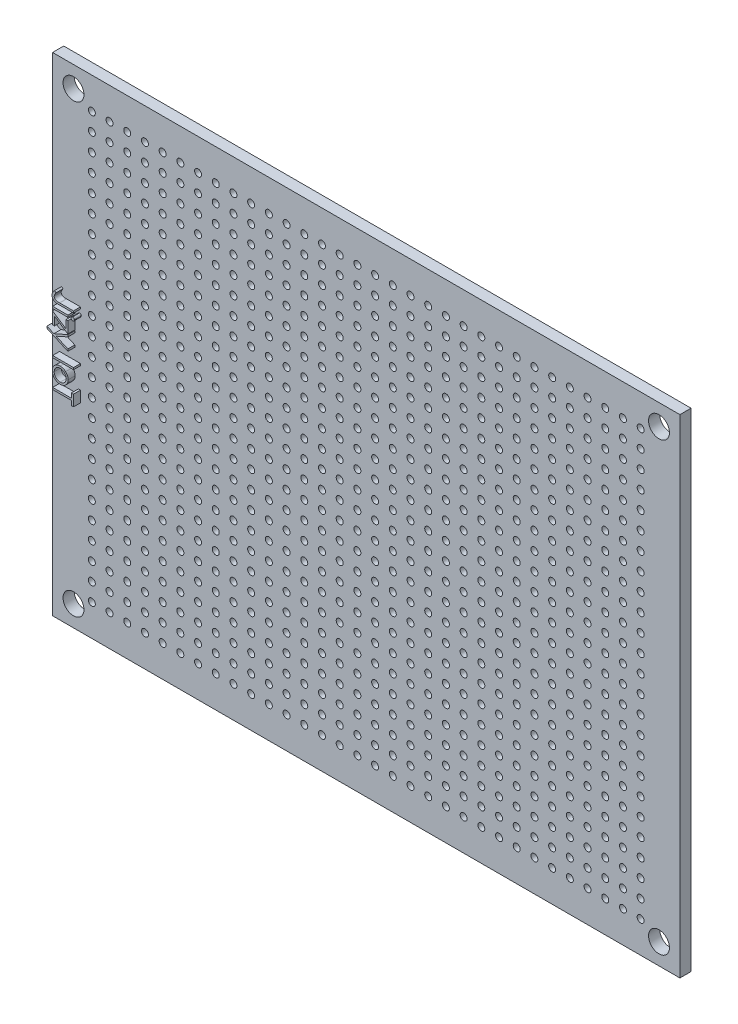
from build123d import *

# Parameters (mm, degrees)
SKETCH1_W           = 90
SKETCH1_H           = 70
SKETCH1_R           = 1.5
SKETCH1_R_2         = 0.5
BOSS_EXTRUDE2_DEPTH = 1.6
SKETCH3_W           = 2.192307692
SKETCH3_H           = 0.26923077
SKETCH3_W_2         = 3
SKETCH3_H_2         = 0.269230769
BOSS_EXTRUDE3_DEPTH = 1


with BuildPart() as part:
    # Sketch1 → Boss-Extrude2 (new body)
    with BuildSketch(Plane.XY):
        Rectangle(SKETCH1_W, SKETCH1_H)
        with Locations((-42, 32)):
            Circle(SKETCH1_R, mode=Mode.SUBTRACT)
        with Locations((42, 32)):
            Circle(SKETCH1_R, mode=Mode.SUBTRACT)
        with Locations((42, -32)):
            Circle(SKETCH1_R, mode=Mode.SUBTRACT)
        with Locations((-42, -32)):
            Circle(SKETCH1_R, mode=Mode.SUBTRACT)
        with Locations((-39.37, 30.48)):
            Circle(SKETCH1_R_2, mode=Mode.SUBTRACT)
        with Locations((-36.83, 30.48)):
            Circle(SKETCH1_R_2, mode=Mode.SUBTRACT)
        with Locations((-34.29, 30.48)):
            Circle(SKETCH1_R_2, mode=Mode.SUBTRACT)
        with Locations((-31.75, 30.48)):
            Circle(SKETCH1_R_2, mode=Mode.SUBTRACT)
        with Locations((-29.21, 30.48)):
            Circle(SKETCH1_R_2, mode=Mode.SUBTRACT)
        with Locations((-26.67, 30.48)):
            Circle(SKETCH1_R_2, mode=Mode.SUBTRACT)
        with Locations((-24.13, 30.48)):
            Circle(SKETCH1_R_2, mode=Mode.SUBTRACT)
        with Locations((-21.59, 30.48)):
            Circle(SKETCH1_R_2, mode=Mode.SUBTRACT)
        with Locations((-19.05, 30.48)):
            Circle(SKETCH1_R_2, mode=Mode.SUBTRACT)
        with Locations((-16.51, 30.48)):
            Circle(SKETCH1_R_2, mode=Mode.SUBTRACT)
        with Locations((-13.97, 30.48)):
            Circle(SKETCH1_R_2, mode=Mode.SUBTRACT)
        with Locations((-11.43, 30.48)):
            Circle(SKETCH1_R_2, mode=Mode.SUBTRACT)
        with Locations((-8.89, 30.48)):
            Circle(SKETCH1_R_2, mode=Mode.SUBTRACT)
        with Locations((-6.35, 30.48)):
            Circle(SKETCH1_R_2, mode=Mode.SUBTRACT)
        with Locations((-3.81, 30.48)):
            Circle(SKETCH1_R_2, mode=Mode.SUBTRACT)
        with Locations((-1.27, 30.48)):
            Circle(SKETCH1_R_2, mode=Mode.SUBTRACT)
        with Locations((1.27, 30.48)):
            Circle(SKETCH1_R_2, mode=Mode.SUBTRACT)
        with Locations((3.81, 30.48)):
            Circle(SKETCH1_R_2, mode=Mode.SUBTRACT)
        with Locations((6.35, 30.48)):
            Circle(SKETCH1_R_2, mode=Mode.SUBTRACT)
        with Locations((8.89, 30.48)):
            Circle(SKETCH1_R_2, mode=Mode.SUBTRACT)
        with Locations((11.43, 30.48)):
            Circle(SKETCH1_R_2, mode=Mode.SUBTRACT)
        with Locations((13.97, 30.48)):
            Circle(SKETCH1_R_2, mode=Mode.SUBTRACT)
        with Locations((16.51, 30.48)):
            Circle(SKETCH1_R_2, mode=Mode.SUBTRACT)
        with Locations((19.05, 30.48)):
            Circle(SKETCH1_R_2, mode=Mode.SUBTRACT)
        with Locations((21.59, 30.48)):
            Circle(SKETCH1_R_2, mode=Mode.SUBTRACT)
        with Locations((24.13, 30.48)):
            Circle(SKETCH1_R_2, mode=Mode.SUBTRACT)
        with Locations((26.67, 30.48)):
            Circle(SKETCH1_R_2, mode=Mode.SUBTRACT)
        with Locations((29.21, 30.48)):
            Circle(SKETCH1_R_2, mode=Mode.SUBTRACT)
        with Locations((31.75, 30.48)):
            Circle(SKETCH1_R_2, mode=Mode.SUBTRACT)
        with Locations((34.29, 30.48)):
            Circle(SKETCH1_R_2, mode=Mode.SUBTRACT)
        with Locations((36.83, 30.48)):
            Circle(SKETCH1_R_2, mode=Mode.SUBTRACT)
        with Locations((39.37, 30.48)):
            Circle(SKETCH1_R_2, mode=Mode.SUBTRACT)
        with Locations((-36.83, 27.94)):
            Circle(SKETCH1_R_2, mode=Mode.SUBTRACT)
        with Locations((-34.29, 27.94)):
            Circle(SKETCH1_R_2, mode=Mode.SUBTRACT)
        with Locations((-31.75, 27.94)):
            Circle(SKETCH1_R_2, mode=Mode.SUBTRACT)
        with Locations((-29.21, 27.94)):
            Circle(SKETCH1_R_2, mode=Mode.SUBTRACT)
        with Locations((-26.67, 27.94)):
            Circle(SKETCH1_R_2, mode=Mode.SUBTRACT)
        with Locations((-24.13, 27.94)):
            Circle(SKETCH1_R_2, mode=Mode.SUBTRACT)
        with Locations((-21.59, 27.94)):
            Circle(SKETCH1_R_2, mode=Mode.SUBTRACT)
        with Locations((-19.05, 27.94)):
            Circle(SKETCH1_R_2, mode=Mode.SUBTRACT)
        with Locations((-16.51, 27.94)):
            Circle(SKETCH1_R_2, mode=Mode.SUBTRACT)
        with Locations((-13.97, 27.94)):
            Circle(SKETCH1_R_2, mode=Mode.SUBTRACT)
        with Locations((-11.43, 27.94)):
            Circle(SKETCH1_R_2, mode=Mode.SUBTRACT)
        with Locations((-8.89, 27.94)):
            Circle(SKETCH1_R_2, mode=Mode.SUBTRACT)
        with Locations((-6.35, 27.94)):
            Circle(SKETCH1_R_2, mode=Mode.SUBTRACT)
        with Locations((-3.81, 27.94)):
            Circle(SKETCH1_R_2, mode=Mode.SUBTRACT)
        with Locations((-1.27, 27.94)):
            Circle(SKETCH1_R_2, mode=Mode.SUBTRACT)
        with Locations((1.27, 27.94)):
            Circle(SKETCH1_R_2, mode=Mode.SUBTRACT)
        with Locations((3.81, 27.94)):
            Circle(SKETCH1_R_2, mode=Mode.SUBTRACT)
        with Locations((6.35, 27.94)):
            Circle(SKETCH1_R_2, mode=Mode.SUBTRACT)
        with Locations((8.89, 27.94)):
            Circle(SKETCH1_R_2, mode=Mode.SUBTRACT)
        with Locations((11.43, 27.94)):
            Circle(SKETCH1_R_2, mode=Mode.SUBTRACT)
        with Locations((13.97, 27.94)):
            Circle(SKETCH1_R_2, mode=Mode.SUBTRACT)
        with Locations((16.51, 27.94)):
            Circle(SKETCH1_R_2, mode=Mode.SUBTRACT)
        with Locations((19.05, 27.94)):
            Circle(SKETCH1_R_2, mode=Mode.SUBTRACT)
        with Locations((21.59, 27.94)):
            Circle(SKETCH1_R_2, mode=Mode.SUBTRACT)
        with Locations((24.13, 27.94)):
            Circle(SKETCH1_R_2, mode=Mode.SUBTRACT)
        with Locations((26.67, 27.94)):
            Circle(SKETCH1_R_2, mode=Mode.SUBTRACT)
        with Locations((29.21, 27.94)):
            Circle(SKETCH1_R_2, mode=Mode.SUBTRACT)
        with Locations((31.75, 27.94)):
            Circle(SKETCH1_R_2, mode=Mode.SUBTRACT)
        with Locations((34.29, 27.94)):
            Circle(SKETCH1_R_2, mode=Mode.SUBTRACT)
        with Locations((36.83, 27.94)):
            Circle(SKETCH1_R_2, mode=Mode.SUBTRACT)
        with Locations((39.37, 27.94)):
            Circle(SKETCH1_R_2, mode=Mode.SUBTRACT)
        with Locations((-36.83, 25.4)):
            Circle(SKETCH1_R_2, mode=Mode.SUBTRACT)
        with Locations((-34.29, 25.4)):
            Circle(SKETCH1_R_2, mode=Mode.SUBTRACT)
        with Locations((-31.75, 25.4)):
            Circle(SKETCH1_R_2, mode=Mode.SUBTRACT)
        with Locations((-29.21, 25.4)):
            Circle(SKETCH1_R_2, mode=Mode.SUBTRACT)
        with Locations((-26.67, 25.4)):
            Circle(SKETCH1_R_2, mode=Mode.SUBTRACT)
        with Locations((-24.13, 25.4)):
            Circle(SKETCH1_R_2, mode=Mode.SUBTRACT)
        with Locations((-21.59, 25.4)):
            Circle(SKETCH1_R_2, mode=Mode.SUBTRACT)
        with Locations((-19.05, 25.4)):
            Circle(SKETCH1_R_2, mode=Mode.SUBTRACT)
        with Locations((-16.51, 25.4)):
            Circle(SKETCH1_R_2, mode=Mode.SUBTRACT)
        with Locations((-13.97, 25.4)):
            Circle(SKETCH1_R_2, mode=Mode.SUBTRACT)
        with Locations((-11.43, 25.4)):
            Circle(SKETCH1_R_2, mode=Mode.SUBTRACT)
        with Locations((-8.89, 25.4)):
            Circle(SKETCH1_R_2, mode=Mode.SUBTRACT)
        with Locations((-6.35, 25.4)):
            Circle(SKETCH1_R_2, mode=Mode.SUBTRACT)
        with Locations((-3.81, 25.4)):
            Circle(SKETCH1_R_2, mode=Mode.SUBTRACT)
        with Locations((-1.27, 25.4)):
            Circle(SKETCH1_R_2, mode=Mode.SUBTRACT)
        with Locations((1.27, 25.4)):
            Circle(SKETCH1_R_2, mode=Mode.SUBTRACT)
        with Locations((3.81, 25.4)):
            Circle(SKETCH1_R_2, mode=Mode.SUBTRACT)
        with Locations((6.35, 25.4)):
            Circle(SKETCH1_R_2, mode=Mode.SUBTRACT)
        with Locations((8.89, 25.4)):
            Circle(SKETCH1_R_2, mode=Mode.SUBTRACT)
        with Locations((11.43, 25.4)):
            Circle(SKETCH1_R_2, mode=Mode.SUBTRACT)
        with Locations((13.97, 25.4)):
            Circle(SKETCH1_R_2, mode=Mode.SUBTRACT)
        with Locations((16.51, 25.4)):
            Circle(SKETCH1_R_2, mode=Mode.SUBTRACT)
        with Locations((19.05, 25.4)):
            Circle(SKETCH1_R_2, mode=Mode.SUBTRACT)
        with Locations((21.59, 25.4)):
            Circle(SKETCH1_R_2, mode=Mode.SUBTRACT)
        with Locations((24.13, 25.4)):
            Circle(SKETCH1_R_2, mode=Mode.SUBTRACT)
        with Locations((26.67, 25.4)):
            Circle(SKETCH1_R_2, mode=Mode.SUBTRACT)
        with Locations((29.21, 25.4)):
            Circle(SKETCH1_R_2, mode=Mode.SUBTRACT)
        with Locations((31.75, 25.4)):
            Circle(SKETCH1_R_2, mode=Mode.SUBTRACT)
        with Locations((34.29, 25.4)):
            Circle(SKETCH1_R_2, mode=Mode.SUBTRACT)
        with Locations((36.83, 25.4)):
            Circle(SKETCH1_R_2, mode=Mode.SUBTRACT)
        with Locations((39.37, 25.4)):
            Circle(SKETCH1_R_2, mode=Mode.SUBTRACT)
        with Locations((-36.83, 22.86)):
            Circle(SKETCH1_R_2, mode=Mode.SUBTRACT)
        with Locations((-34.29, 22.86)):
            Circle(SKETCH1_R_2, mode=Mode.SUBTRACT)
        with Locations((-31.75, 22.86)):
            Circle(SKETCH1_R_2, mode=Mode.SUBTRACT)
        with Locations((-29.21, 22.86)):
            Circle(SKETCH1_R_2, mode=Mode.SUBTRACT)
        with Locations((-26.67, 22.86)):
            Circle(SKETCH1_R_2, mode=Mode.SUBTRACT)
        with Locations((-24.13, 22.86)):
            Circle(SKETCH1_R_2, mode=Mode.SUBTRACT)
        with Locations((-21.59, 22.86)):
            Circle(SKETCH1_R_2, mode=Mode.SUBTRACT)
        with Locations((-19.05, 22.86)):
            Circle(SKETCH1_R_2, mode=Mode.SUBTRACT)
        with Locations((-16.51, 22.86)):
            Circle(SKETCH1_R_2, mode=Mode.SUBTRACT)
        with Locations((-13.97, 22.86)):
            Circle(SKETCH1_R_2, mode=Mode.SUBTRACT)
        with Locations((-11.43, 22.86)):
            Circle(SKETCH1_R_2, mode=Mode.SUBTRACT)
        with Locations((-8.89, 22.86)):
            Circle(SKETCH1_R_2, mode=Mode.SUBTRACT)
        with Locations((-6.35, 22.86)):
            Circle(SKETCH1_R_2, mode=Mode.SUBTRACT)
        with Locations((-3.81, 22.86)):
            Circle(SKETCH1_R_2, mode=Mode.SUBTRACT)
        with Locations((-1.27, 22.86)):
            Circle(SKETCH1_R_2, mode=Mode.SUBTRACT)
        with Locations((1.27, 22.86)):
            Circle(SKETCH1_R_2, mode=Mode.SUBTRACT)
        with Locations((3.81, 22.86)):
            Circle(SKETCH1_R_2, mode=Mode.SUBTRACT)
        with Locations((6.35, 22.86)):
            Circle(SKETCH1_R_2, mode=Mode.SUBTRACT)
        with Locations((8.89, 22.86)):
            Circle(SKETCH1_R_2, mode=Mode.SUBTRACT)
        with Locations((11.43, 22.86)):
            Circle(SKETCH1_R_2, mode=Mode.SUBTRACT)
        with Locations((13.97, 22.86)):
            Circle(SKETCH1_R_2, mode=Mode.SUBTRACT)
        with Locations((16.51, 22.86)):
            Circle(SKETCH1_R_2, mode=Mode.SUBTRACT)
        with Locations((19.05, 22.86)):
            Circle(SKETCH1_R_2, mode=Mode.SUBTRACT)
        with Locations((21.59, 22.86)):
            Circle(SKETCH1_R_2, mode=Mode.SUBTRACT)
        with Locations((24.13, 22.86)):
            Circle(SKETCH1_R_2, mode=Mode.SUBTRACT)
        with Locations((26.67, 22.86)):
            Circle(SKETCH1_R_2, mode=Mode.SUBTRACT)
        with Locations((29.21, 22.86)):
            Circle(SKETCH1_R_2, mode=Mode.SUBTRACT)
        with Locations((31.75, 22.86)):
            Circle(SKETCH1_R_2, mode=Mode.SUBTRACT)
        with Locations((34.29, 22.86)):
            Circle(SKETCH1_R_2, mode=Mode.SUBTRACT)
        with Locations((36.83, 22.86)):
            Circle(SKETCH1_R_2, mode=Mode.SUBTRACT)
        with Locations((39.37, 22.86)):
            Circle(SKETCH1_R_2, mode=Mode.SUBTRACT)
        with Locations((-36.83, 20.32)):
            Circle(SKETCH1_R_2, mode=Mode.SUBTRACT)
        with Locations((-34.29, 20.32)):
            Circle(SKETCH1_R_2, mode=Mode.SUBTRACT)
        with Locations((-31.75, 20.32)):
            Circle(SKETCH1_R_2, mode=Mode.SUBTRACT)
        with Locations((-29.21, 20.32)):
            Circle(SKETCH1_R_2, mode=Mode.SUBTRACT)
        with Locations((-26.67, 20.32)):
            Circle(SKETCH1_R_2, mode=Mode.SUBTRACT)
        with Locations((-24.13, 20.32)):
            Circle(SKETCH1_R_2, mode=Mode.SUBTRACT)
        with Locations((-21.59, 20.32)):
            Circle(SKETCH1_R_2, mode=Mode.SUBTRACT)
        with Locations((-19.05, 20.32)):
            Circle(SKETCH1_R_2, mode=Mode.SUBTRACT)
        with Locations((-16.51, 20.32)):
            Circle(SKETCH1_R_2, mode=Mode.SUBTRACT)
        with Locations((-13.97, 20.32)):
            Circle(SKETCH1_R_2, mode=Mode.SUBTRACT)
        with Locations((-11.43, 20.32)):
            Circle(SKETCH1_R_2, mode=Mode.SUBTRACT)
        with Locations((-8.89, 20.32)):
            Circle(SKETCH1_R_2, mode=Mode.SUBTRACT)
        with Locations((-6.35, 20.32)):
            Circle(SKETCH1_R_2, mode=Mode.SUBTRACT)
        with Locations((-3.81, 20.32)):
            Circle(SKETCH1_R_2, mode=Mode.SUBTRACT)
        with Locations((-1.27, 20.32)):
            Circle(SKETCH1_R_2, mode=Mode.SUBTRACT)
        with Locations((1.27, 20.32)):
            Circle(SKETCH1_R_2, mode=Mode.SUBTRACT)
        with Locations((3.81, 20.32)):
            Circle(SKETCH1_R_2, mode=Mode.SUBTRACT)
        with Locations((6.35, 20.32)):
            Circle(SKETCH1_R_2, mode=Mode.SUBTRACT)
        with Locations((8.89, 20.32)):
            Circle(SKETCH1_R_2, mode=Mode.SUBTRACT)
        with Locations((11.43, 20.32)):
            Circle(SKETCH1_R_2, mode=Mode.SUBTRACT)
        with Locations((13.97, 20.32)):
            Circle(SKETCH1_R_2, mode=Mode.SUBTRACT)
        with Locations((16.51, 20.32)):
            Circle(SKETCH1_R_2, mode=Mode.SUBTRACT)
        with Locations((19.05, 20.32)):
            Circle(SKETCH1_R_2, mode=Mode.SUBTRACT)
        with Locations((21.59, 20.32)):
            Circle(SKETCH1_R_2, mode=Mode.SUBTRACT)
        with Locations((24.13, 20.32)):
            Circle(SKETCH1_R_2, mode=Mode.SUBTRACT)
        with Locations((26.67, 20.32)):
            Circle(SKETCH1_R_2, mode=Mode.SUBTRACT)
        with Locations((29.21, 20.32)):
            Circle(SKETCH1_R_2, mode=Mode.SUBTRACT)
        with Locations((31.75, 20.32)):
            Circle(SKETCH1_R_2, mode=Mode.SUBTRACT)
        with Locations((34.29, 20.32)):
            Circle(SKETCH1_R_2, mode=Mode.SUBTRACT)
        with Locations((36.83, 20.32)):
            Circle(SKETCH1_R_2, mode=Mode.SUBTRACT)
        with Locations((39.37, 20.32)):
            Circle(SKETCH1_R_2, mode=Mode.SUBTRACT)
        with Locations((-36.83, 17.78)):
            Circle(SKETCH1_R_2, mode=Mode.SUBTRACT)
        with Locations((-34.29, 17.78)):
            Circle(SKETCH1_R_2, mode=Mode.SUBTRACT)
        with Locations((-31.75, 17.78)):
            Circle(SKETCH1_R_2, mode=Mode.SUBTRACT)
        with Locations((-29.21, 17.78)):
            Circle(SKETCH1_R_2, mode=Mode.SUBTRACT)
        with Locations((-26.67, 17.78)):
            Circle(SKETCH1_R_2, mode=Mode.SUBTRACT)
        with Locations((-24.13, 17.78)):
            Circle(SKETCH1_R_2, mode=Mode.SUBTRACT)
        with Locations((-21.59, 17.78)):
            Circle(SKETCH1_R_2, mode=Mode.SUBTRACT)
        with Locations((-19.05, 17.78)):
            Circle(SKETCH1_R_2, mode=Mode.SUBTRACT)
        with Locations((-16.51, 17.78)):
            Circle(SKETCH1_R_2, mode=Mode.SUBTRACT)
        with Locations((-13.97, 17.78)):
            Circle(SKETCH1_R_2, mode=Mode.SUBTRACT)
        with Locations((-11.43, 17.78)):
            Circle(SKETCH1_R_2, mode=Mode.SUBTRACT)
        with Locations((-8.89, 17.78)):
            Circle(SKETCH1_R_2, mode=Mode.SUBTRACT)
        with Locations((-6.35, 17.78)):
            Circle(SKETCH1_R_2, mode=Mode.SUBTRACT)
        with Locations((-3.81, 17.78)):
            Circle(SKETCH1_R_2, mode=Mode.SUBTRACT)
        with Locations((-1.27, 17.78)):
            Circle(SKETCH1_R_2, mode=Mode.SUBTRACT)
        with Locations((1.27, 17.78)):
            Circle(SKETCH1_R_2, mode=Mode.SUBTRACT)
        with Locations((3.81, 17.78)):
            Circle(SKETCH1_R_2, mode=Mode.SUBTRACT)
        with Locations((6.35, 17.78)):
            Circle(SKETCH1_R_2, mode=Mode.SUBTRACT)
        with Locations((8.89, 17.78)):
            Circle(SKETCH1_R_2, mode=Mode.SUBTRACT)
        with Locations((11.43, 17.78)):
            Circle(SKETCH1_R_2, mode=Mode.SUBTRACT)
        with Locations((13.97, 17.78)):
            Circle(SKETCH1_R_2, mode=Mode.SUBTRACT)
        with Locations((16.51, 17.78)):
            Circle(SKETCH1_R_2, mode=Mode.SUBTRACT)
        with Locations((19.05, 17.78)):
            Circle(SKETCH1_R_2, mode=Mode.SUBTRACT)
        with Locations((21.59, 17.78)):
            Circle(SKETCH1_R_2, mode=Mode.SUBTRACT)
        with Locations((24.13, 17.78)):
            Circle(SKETCH1_R_2, mode=Mode.SUBTRACT)
        with Locations((26.67, 17.78)):
            Circle(SKETCH1_R_2, mode=Mode.SUBTRACT)
        with Locations((29.21, 17.78)):
            Circle(SKETCH1_R_2, mode=Mode.SUBTRACT)
        with Locations((31.75, 17.78)):
            Circle(SKETCH1_R_2, mode=Mode.SUBTRACT)
        with Locations((34.29, 17.78)):
            Circle(SKETCH1_R_2, mode=Mode.SUBTRACT)
        with Locations((36.83, 17.78)):
            Circle(SKETCH1_R_2, mode=Mode.SUBTRACT)
        with Locations((39.37, 17.78)):
            Circle(SKETCH1_R_2, mode=Mode.SUBTRACT)
        with Locations((-36.83, 15.24)):
            Circle(SKETCH1_R_2, mode=Mode.SUBTRACT)
        with Locations((-34.29, 15.24)):
            Circle(SKETCH1_R_2, mode=Mode.SUBTRACT)
        with Locations((-31.75, 15.24)):
            Circle(SKETCH1_R_2, mode=Mode.SUBTRACT)
        with Locations((-29.21, 15.24)):
            Circle(SKETCH1_R_2, mode=Mode.SUBTRACT)
        with Locations((-26.67, 15.24)):
            Circle(SKETCH1_R_2, mode=Mode.SUBTRACT)
        with Locations((-24.13, 15.24)):
            Circle(SKETCH1_R_2, mode=Mode.SUBTRACT)
        with Locations((-21.59, 15.24)):
            Circle(SKETCH1_R_2, mode=Mode.SUBTRACT)
        with Locations((-19.05, 15.24)):
            Circle(SKETCH1_R_2, mode=Mode.SUBTRACT)
        with Locations((-16.51, 15.24)):
            Circle(SKETCH1_R_2, mode=Mode.SUBTRACT)
        with Locations((-13.97, 15.24)):
            Circle(SKETCH1_R_2, mode=Mode.SUBTRACT)
        with Locations((-11.43, 15.24)):
            Circle(SKETCH1_R_2, mode=Mode.SUBTRACT)
        with Locations((-8.89, 15.24)):
            Circle(SKETCH1_R_2, mode=Mode.SUBTRACT)
        with Locations((-6.35, 15.24)):
            Circle(SKETCH1_R_2, mode=Mode.SUBTRACT)
        with Locations((-3.81, 15.24)):
            Circle(SKETCH1_R_2, mode=Mode.SUBTRACT)
        with Locations((-1.27, 15.24)):
            Circle(SKETCH1_R_2, mode=Mode.SUBTRACT)
        with Locations((1.27, 15.24)):
            Circle(SKETCH1_R_2, mode=Mode.SUBTRACT)
        with Locations((3.81, 15.24)):
            Circle(SKETCH1_R_2, mode=Mode.SUBTRACT)
        with Locations((6.35, 15.24)):
            Circle(SKETCH1_R_2, mode=Mode.SUBTRACT)
        with Locations((8.89, 15.24)):
            Circle(SKETCH1_R_2, mode=Mode.SUBTRACT)
        with Locations((11.43, 15.24)):
            Circle(SKETCH1_R_2, mode=Mode.SUBTRACT)
        with Locations((13.97, 15.24)):
            Circle(SKETCH1_R_2, mode=Mode.SUBTRACT)
        with Locations((16.51, 15.24)):
            Circle(SKETCH1_R_2, mode=Mode.SUBTRACT)
        with Locations((19.05, 15.24)):
            Circle(SKETCH1_R_2, mode=Mode.SUBTRACT)
        with Locations((21.59, 15.24)):
            Circle(SKETCH1_R_2, mode=Mode.SUBTRACT)
        with Locations((24.13, 15.24)):
            Circle(SKETCH1_R_2, mode=Mode.SUBTRACT)
        with Locations((26.67, 15.24)):
            Circle(SKETCH1_R_2, mode=Mode.SUBTRACT)
        with Locations((29.21, 15.24)):
            Circle(SKETCH1_R_2, mode=Mode.SUBTRACT)
        with Locations((31.75, 15.24)):
            Circle(SKETCH1_R_2, mode=Mode.SUBTRACT)
        with Locations((34.29, 15.24)):
            Circle(SKETCH1_R_2, mode=Mode.SUBTRACT)
        with Locations((36.83, 15.24)):
            Circle(SKETCH1_R_2, mode=Mode.SUBTRACT)
        with Locations((39.37, 15.24)):
            Circle(SKETCH1_R_2, mode=Mode.SUBTRACT)
        with Locations((-36.83, 12.7)):
            Circle(SKETCH1_R_2, mode=Mode.SUBTRACT)
        with Locations((-34.29, 12.7)):
            Circle(SKETCH1_R_2, mode=Mode.SUBTRACT)
        with Locations((-31.75, 12.7)):
            Circle(SKETCH1_R_2, mode=Mode.SUBTRACT)
        with Locations((-29.21, 12.7)):
            Circle(SKETCH1_R_2, mode=Mode.SUBTRACT)
        with Locations((-26.67, 12.7)):
            Circle(SKETCH1_R_2, mode=Mode.SUBTRACT)
        with Locations((-24.13, 12.7)):
            Circle(SKETCH1_R_2, mode=Mode.SUBTRACT)
        with Locations((-21.59, 12.7)):
            Circle(SKETCH1_R_2, mode=Mode.SUBTRACT)
        with Locations((-19.05, 12.7)):
            Circle(SKETCH1_R_2, mode=Mode.SUBTRACT)
        with Locations((-16.51, 12.7)):
            Circle(SKETCH1_R_2, mode=Mode.SUBTRACT)
        with Locations((-13.97, 12.7)):
            Circle(SKETCH1_R_2, mode=Mode.SUBTRACT)
        with Locations((-11.43, 12.7)):
            Circle(SKETCH1_R_2, mode=Mode.SUBTRACT)
        with Locations((-8.89, 12.7)):
            Circle(SKETCH1_R_2, mode=Mode.SUBTRACT)
        with Locations((-6.35, 12.7)):
            Circle(SKETCH1_R_2, mode=Mode.SUBTRACT)
        with Locations((-3.81, 12.7)):
            Circle(SKETCH1_R_2, mode=Mode.SUBTRACT)
        with Locations((-1.27, 12.7)):
            Circle(SKETCH1_R_2, mode=Mode.SUBTRACT)
        with Locations((1.27, 12.7)):
            Circle(SKETCH1_R_2, mode=Mode.SUBTRACT)
        with Locations((3.81, 12.7)):
            Circle(SKETCH1_R_2, mode=Mode.SUBTRACT)
        with Locations((6.35, 12.7)):
            Circle(SKETCH1_R_2, mode=Mode.SUBTRACT)
        with Locations((8.89, 12.7)):
            Circle(SKETCH1_R_2, mode=Mode.SUBTRACT)
        with Locations((11.43, 12.7)):
            Circle(SKETCH1_R_2, mode=Mode.SUBTRACT)
        with Locations((13.97, 12.7)):
            Circle(SKETCH1_R_2, mode=Mode.SUBTRACT)
        with Locations((16.51, 12.7)):
            Circle(SKETCH1_R_2, mode=Mode.SUBTRACT)
        with Locations((19.05, 12.7)):
            Circle(SKETCH1_R_2, mode=Mode.SUBTRACT)
        with Locations((21.59, 12.7)):
            Circle(SKETCH1_R_2, mode=Mode.SUBTRACT)
        with Locations((24.13, 12.7)):
            Circle(SKETCH1_R_2, mode=Mode.SUBTRACT)
        with Locations((26.67, 12.7)):
            Circle(SKETCH1_R_2, mode=Mode.SUBTRACT)
        with Locations((29.21, 12.7)):
            Circle(SKETCH1_R_2, mode=Mode.SUBTRACT)
        with Locations((31.75, 12.7)):
            Circle(SKETCH1_R_2, mode=Mode.SUBTRACT)
        with Locations((34.29, 12.7)):
            Circle(SKETCH1_R_2, mode=Mode.SUBTRACT)
        with Locations((36.83, 12.7)):
            Circle(SKETCH1_R_2, mode=Mode.SUBTRACT)
        with Locations((39.37, 12.7)):
            Circle(SKETCH1_R_2, mode=Mode.SUBTRACT)
        with Locations((-36.83, 10.16)):
            Circle(SKETCH1_R_2, mode=Mode.SUBTRACT)
        with Locations((-34.29, 10.16)):
            Circle(SKETCH1_R_2, mode=Mode.SUBTRACT)
        with Locations((-31.75, 10.16)):
            Circle(SKETCH1_R_2, mode=Mode.SUBTRACT)
        with Locations((-29.21, 10.16)):
            Circle(SKETCH1_R_2, mode=Mode.SUBTRACT)
        with Locations((-26.67, 10.16)):
            Circle(SKETCH1_R_2, mode=Mode.SUBTRACT)
        with Locations((-24.13, 10.16)):
            Circle(SKETCH1_R_2, mode=Mode.SUBTRACT)
        with Locations((-21.59, 10.16)):
            Circle(SKETCH1_R_2, mode=Mode.SUBTRACT)
        with Locations((-19.05, 10.16)):
            Circle(SKETCH1_R_2, mode=Mode.SUBTRACT)
        with Locations((-16.51, 10.16)):
            Circle(SKETCH1_R_2, mode=Mode.SUBTRACT)
        with Locations((-13.97, 10.16)):
            Circle(SKETCH1_R_2, mode=Mode.SUBTRACT)
        with Locations((-11.43, 10.16)):
            Circle(SKETCH1_R_2, mode=Mode.SUBTRACT)
        with Locations((-8.89, 10.16)):
            Circle(SKETCH1_R_2, mode=Mode.SUBTRACT)
        with Locations((-6.35, 10.16)):
            Circle(SKETCH1_R_2, mode=Mode.SUBTRACT)
        with Locations((-3.81, 10.16)):
            Circle(SKETCH1_R_2, mode=Mode.SUBTRACT)
        with Locations((-1.27, 10.16)):
            Circle(SKETCH1_R_2, mode=Mode.SUBTRACT)
        with Locations((1.27, 10.16)):
            Circle(SKETCH1_R_2, mode=Mode.SUBTRACT)
        with Locations((3.81, 10.16)):
            Circle(SKETCH1_R_2, mode=Mode.SUBTRACT)
        with Locations((6.35, 10.16)):
            Circle(SKETCH1_R_2, mode=Mode.SUBTRACT)
        with Locations((8.89, 10.16)):
            Circle(SKETCH1_R_2, mode=Mode.SUBTRACT)
        with Locations((11.43, 10.16)):
            Circle(SKETCH1_R_2, mode=Mode.SUBTRACT)
        with Locations((13.97, 10.16)):
            Circle(SKETCH1_R_2, mode=Mode.SUBTRACT)
        with Locations((16.51, 10.16)):
            Circle(SKETCH1_R_2, mode=Mode.SUBTRACT)
        with Locations((19.05, 10.16)):
            Circle(SKETCH1_R_2, mode=Mode.SUBTRACT)
        with Locations((21.59, 10.16)):
            Circle(SKETCH1_R_2, mode=Mode.SUBTRACT)
        with Locations((24.13, 10.16)):
            Circle(SKETCH1_R_2, mode=Mode.SUBTRACT)
        with Locations((26.67, 10.16)):
            Circle(SKETCH1_R_2, mode=Mode.SUBTRACT)
        with Locations((29.21, 10.16)):
            Circle(SKETCH1_R_2, mode=Mode.SUBTRACT)
        with Locations((31.75, 10.16)):
            Circle(SKETCH1_R_2, mode=Mode.SUBTRACT)
        with Locations((34.29, 10.16)):
            Circle(SKETCH1_R_2, mode=Mode.SUBTRACT)
        with Locations((36.83, 10.16)):
            Circle(SKETCH1_R_2, mode=Mode.SUBTRACT)
        with Locations((39.37, 10.16)):
            Circle(SKETCH1_R_2, mode=Mode.SUBTRACT)
        with Locations((-36.83, 7.62)):
            Circle(SKETCH1_R_2, mode=Mode.SUBTRACT)
        with Locations((-34.29, 7.62)):
            Circle(SKETCH1_R_2, mode=Mode.SUBTRACT)
        with Locations((-31.75, 7.62)):
            Circle(SKETCH1_R_2, mode=Mode.SUBTRACT)
        with Locations((-29.21, 7.62)):
            Circle(SKETCH1_R_2, mode=Mode.SUBTRACT)
        with Locations((-26.67, 7.62)):
            Circle(SKETCH1_R_2, mode=Mode.SUBTRACT)
        with Locations((-24.13, 7.62)):
            Circle(SKETCH1_R_2, mode=Mode.SUBTRACT)
        with Locations((-21.59, 7.62)):
            Circle(SKETCH1_R_2, mode=Mode.SUBTRACT)
        with Locations((-19.05, 7.62)):
            Circle(SKETCH1_R_2, mode=Mode.SUBTRACT)
        with Locations((-16.51, 7.62)):
            Circle(SKETCH1_R_2, mode=Mode.SUBTRACT)
        with Locations((-13.97, 7.62)):
            Circle(SKETCH1_R_2, mode=Mode.SUBTRACT)
        with Locations((-11.43, 7.62)):
            Circle(SKETCH1_R_2, mode=Mode.SUBTRACT)
        with Locations((-8.89, 7.62)):
            Circle(SKETCH1_R_2, mode=Mode.SUBTRACT)
        with Locations((-6.35, 7.62)):
            Circle(SKETCH1_R_2, mode=Mode.SUBTRACT)
        with Locations((-3.81, 7.62)):
            Circle(SKETCH1_R_2, mode=Mode.SUBTRACT)
        with Locations((-1.27, 7.62)):
            Circle(SKETCH1_R_2, mode=Mode.SUBTRACT)
        with Locations((1.27, 7.62)):
            Circle(SKETCH1_R_2, mode=Mode.SUBTRACT)
        with Locations((3.81, 7.62)):
            Circle(SKETCH1_R_2, mode=Mode.SUBTRACT)
        with Locations((6.35, 7.62)):
            Circle(SKETCH1_R_2, mode=Mode.SUBTRACT)
        with Locations((8.89, 7.62)):
            Circle(SKETCH1_R_2, mode=Mode.SUBTRACT)
        with Locations((11.43, 7.62)):
            Circle(SKETCH1_R_2, mode=Mode.SUBTRACT)
        with Locations((13.97, 7.62)):
            Circle(SKETCH1_R_2, mode=Mode.SUBTRACT)
        with Locations((16.51, 7.62)):
            Circle(SKETCH1_R_2, mode=Mode.SUBTRACT)
        with Locations((19.05, 7.62)):
            Circle(SKETCH1_R_2, mode=Mode.SUBTRACT)
        with Locations((21.59, 7.62)):
            Circle(SKETCH1_R_2, mode=Mode.SUBTRACT)
        with Locations((24.13, 7.62)):
            Circle(SKETCH1_R_2, mode=Mode.SUBTRACT)
        with Locations((26.67, 7.62)):
            Circle(SKETCH1_R_2, mode=Mode.SUBTRACT)
        with Locations((29.21, 7.62)):
            Circle(SKETCH1_R_2, mode=Mode.SUBTRACT)
        with Locations((31.75, 7.62)):
            Circle(SKETCH1_R_2, mode=Mode.SUBTRACT)
        with Locations((34.29, 7.62)):
            Circle(SKETCH1_R_2, mode=Mode.SUBTRACT)
        with Locations((36.83, 7.62)):
            Circle(SKETCH1_R_2, mode=Mode.SUBTRACT)
        with Locations((39.37, 7.62)):
            Circle(SKETCH1_R_2, mode=Mode.SUBTRACT)
        with Locations((-36.83, 5.08)):
            Circle(SKETCH1_R_2, mode=Mode.SUBTRACT)
        with Locations((-34.29, 5.08)):
            Circle(SKETCH1_R_2, mode=Mode.SUBTRACT)
        with Locations((-31.75, 5.08)):
            Circle(SKETCH1_R_2, mode=Mode.SUBTRACT)
        with Locations((-29.21, 5.08)):
            Circle(SKETCH1_R_2, mode=Mode.SUBTRACT)
        with Locations((-26.67, 5.08)):
            Circle(SKETCH1_R_2, mode=Mode.SUBTRACT)
        with Locations((-24.13, 5.08)):
            Circle(SKETCH1_R_2, mode=Mode.SUBTRACT)
        with Locations((-21.59, 5.08)):
            Circle(SKETCH1_R_2, mode=Mode.SUBTRACT)
        with Locations((-19.05, 5.08)):
            Circle(SKETCH1_R_2, mode=Mode.SUBTRACT)
        with Locations((-16.51, 5.08)):
            Circle(SKETCH1_R_2, mode=Mode.SUBTRACT)
        with Locations((-13.97, 5.08)):
            Circle(SKETCH1_R_2, mode=Mode.SUBTRACT)
        with Locations((-11.43, 5.08)):
            Circle(SKETCH1_R_2, mode=Mode.SUBTRACT)
        with Locations((-8.89, 5.08)):
            Circle(SKETCH1_R_2, mode=Mode.SUBTRACT)
        with Locations((-6.35, 5.08)):
            Circle(SKETCH1_R_2, mode=Mode.SUBTRACT)
        with Locations((-3.81, 5.08)):
            Circle(SKETCH1_R_2, mode=Mode.SUBTRACT)
        with Locations((-1.27, 5.08)):
            Circle(SKETCH1_R_2, mode=Mode.SUBTRACT)
        with Locations((1.27, 5.08)):
            Circle(SKETCH1_R_2, mode=Mode.SUBTRACT)
        with Locations((3.81, 5.08)):
            Circle(SKETCH1_R_2, mode=Mode.SUBTRACT)
        with Locations((6.35, 5.08)):
            Circle(SKETCH1_R_2, mode=Mode.SUBTRACT)
        with Locations((8.89, 5.08)):
            Circle(SKETCH1_R_2, mode=Mode.SUBTRACT)
        with Locations((11.43, 5.08)):
            Circle(SKETCH1_R_2, mode=Mode.SUBTRACT)
        with Locations((13.97, 5.08)):
            Circle(SKETCH1_R_2, mode=Mode.SUBTRACT)
        with Locations((16.51, 5.08)):
            Circle(SKETCH1_R_2, mode=Mode.SUBTRACT)
        with Locations((19.05, 5.08)):
            Circle(SKETCH1_R_2, mode=Mode.SUBTRACT)
        with Locations((21.59, 5.08)):
            Circle(SKETCH1_R_2, mode=Mode.SUBTRACT)
        with Locations((24.13, 5.08)):
            Circle(SKETCH1_R_2, mode=Mode.SUBTRACT)
        with Locations((26.67, 5.08)):
            Circle(SKETCH1_R_2, mode=Mode.SUBTRACT)
        with Locations((29.21, 5.08)):
            Circle(SKETCH1_R_2, mode=Mode.SUBTRACT)
        with Locations((31.75, 5.08)):
            Circle(SKETCH1_R_2, mode=Mode.SUBTRACT)
        with Locations((34.29, 5.08)):
            Circle(SKETCH1_R_2, mode=Mode.SUBTRACT)
        with Locations((36.83, 5.08)):
            Circle(SKETCH1_R_2, mode=Mode.SUBTRACT)
        with Locations((39.37, 5.08)):
            Circle(SKETCH1_R_2, mode=Mode.SUBTRACT)
        with Locations((-36.83, 2.54)):
            Circle(SKETCH1_R_2, mode=Mode.SUBTRACT)
        with Locations((-34.29, 2.54)):
            Circle(SKETCH1_R_2, mode=Mode.SUBTRACT)
        with Locations((-31.75, 2.54)):
            Circle(SKETCH1_R_2, mode=Mode.SUBTRACT)
        with Locations((-29.21, 2.54)):
            Circle(SKETCH1_R_2, mode=Mode.SUBTRACT)
        with Locations((-26.67, 2.54)):
            Circle(SKETCH1_R_2, mode=Mode.SUBTRACT)
        with Locations((-24.13, 2.54)):
            Circle(SKETCH1_R_2, mode=Mode.SUBTRACT)
        with Locations((-21.59, 2.54)):
            Circle(SKETCH1_R_2, mode=Mode.SUBTRACT)
        with Locations((-19.05, 2.54)):
            Circle(SKETCH1_R_2, mode=Mode.SUBTRACT)
        with Locations((-16.51, 2.54)):
            Circle(SKETCH1_R_2, mode=Mode.SUBTRACT)
        with Locations((-13.97, 2.54)):
            Circle(SKETCH1_R_2, mode=Mode.SUBTRACT)
        with Locations((-11.43, 2.54)):
            Circle(SKETCH1_R_2, mode=Mode.SUBTRACT)
        with Locations((-8.89, 2.54)):
            Circle(SKETCH1_R_2, mode=Mode.SUBTRACT)
        with Locations((-6.35, 2.54)):
            Circle(SKETCH1_R_2, mode=Mode.SUBTRACT)
        with Locations((-3.81, 2.54)):
            Circle(SKETCH1_R_2, mode=Mode.SUBTRACT)
        with Locations((-1.27, 2.54)):
            Circle(SKETCH1_R_2, mode=Mode.SUBTRACT)
        with Locations((1.27, 2.54)):
            Circle(SKETCH1_R_2, mode=Mode.SUBTRACT)
        with Locations((3.81, 2.54)):
            Circle(SKETCH1_R_2, mode=Mode.SUBTRACT)
        with Locations((6.35, 2.54)):
            Circle(SKETCH1_R_2, mode=Mode.SUBTRACT)
        with Locations((8.89, 2.54)):
            Circle(SKETCH1_R_2, mode=Mode.SUBTRACT)
        with Locations((11.43, 2.54)):
            Circle(SKETCH1_R_2, mode=Mode.SUBTRACT)
        with Locations((13.97, 2.54)):
            Circle(SKETCH1_R_2, mode=Mode.SUBTRACT)
        with Locations((16.51, 2.54)):
            Circle(SKETCH1_R_2, mode=Mode.SUBTRACT)
        with Locations((19.05, 2.54)):
            Circle(SKETCH1_R_2, mode=Mode.SUBTRACT)
        with Locations((21.59, 2.54)):
            Circle(SKETCH1_R_2, mode=Mode.SUBTRACT)
        with Locations((24.13, 2.54)):
            Circle(SKETCH1_R_2, mode=Mode.SUBTRACT)
        with Locations((26.67, 2.54)):
            Circle(SKETCH1_R_2, mode=Mode.SUBTRACT)
        with Locations((29.21, 2.54)):
            Circle(SKETCH1_R_2, mode=Mode.SUBTRACT)
        with Locations((31.75, 2.54)):
            Circle(SKETCH1_R_2, mode=Mode.SUBTRACT)
        with Locations((34.29, 2.54)):
            Circle(SKETCH1_R_2, mode=Mode.SUBTRACT)
        with Locations((36.83, 2.54)):
            Circle(SKETCH1_R_2, mode=Mode.SUBTRACT)
        with Locations((39.37, 2.54)):
            Circle(SKETCH1_R_2, mode=Mode.SUBTRACT)
        with Locations((-36.83, 0)):
            Circle(SKETCH1_R_2, mode=Mode.SUBTRACT)
        with Locations((-34.29, 0)):
            Circle(SKETCH1_R_2, mode=Mode.SUBTRACT)
        with Locations((-31.75, 0)):
            Circle(SKETCH1_R_2, mode=Mode.SUBTRACT)
        with Locations((-29.21, 0)):
            Circle(SKETCH1_R_2, mode=Mode.SUBTRACT)
        with Locations((-26.67, 0)):
            Circle(SKETCH1_R_2, mode=Mode.SUBTRACT)
        with Locations((-24.13, 0)):
            Circle(SKETCH1_R_2, mode=Mode.SUBTRACT)
        with Locations((-21.59, 0)):
            Circle(SKETCH1_R_2, mode=Mode.SUBTRACT)
        with Locations((-19.05, 0)):
            Circle(SKETCH1_R_2, mode=Mode.SUBTRACT)
        with Locations((-16.51, 0)):
            Circle(SKETCH1_R_2, mode=Mode.SUBTRACT)
        with Locations((-13.97, 0)):
            Circle(SKETCH1_R_2, mode=Mode.SUBTRACT)
        with Locations((-11.43, 0)):
            Circle(SKETCH1_R_2, mode=Mode.SUBTRACT)
        with Locations((-8.89, 0)):
            Circle(SKETCH1_R_2, mode=Mode.SUBTRACT)
        with Locations((-6.35, 0)):
            Circle(SKETCH1_R_2, mode=Mode.SUBTRACT)
        with Locations((-3.81, 0)):
            Circle(SKETCH1_R_2, mode=Mode.SUBTRACT)
        with Locations((-1.27, 0)):
            Circle(SKETCH1_R_2, mode=Mode.SUBTRACT)
        with Locations((1.27, 0)):
            Circle(SKETCH1_R_2, mode=Mode.SUBTRACT)
        with Locations((3.81, 0)):
            Circle(SKETCH1_R_2, mode=Mode.SUBTRACT)
        with Locations((6.35, 0)):
            Circle(SKETCH1_R_2, mode=Mode.SUBTRACT)
        with Locations((8.89, 0)):
            Circle(SKETCH1_R_2, mode=Mode.SUBTRACT)
        with Locations((11.43, 0)):
            Circle(SKETCH1_R_2, mode=Mode.SUBTRACT)
        with Locations((13.97, 0)):
            Circle(SKETCH1_R_2, mode=Mode.SUBTRACT)
        with Locations((16.51, 0)):
            Circle(SKETCH1_R_2, mode=Mode.SUBTRACT)
        with Locations((19.05, 0)):
            Circle(SKETCH1_R_2, mode=Mode.SUBTRACT)
        with Locations((21.59, 0)):
            Circle(SKETCH1_R_2, mode=Mode.SUBTRACT)
        with Locations((24.13, 0)):
            Circle(SKETCH1_R_2, mode=Mode.SUBTRACT)
        with Locations((26.67, 0)):
            Circle(SKETCH1_R_2, mode=Mode.SUBTRACT)
        with Locations((29.21, 0)):
            Circle(SKETCH1_R_2, mode=Mode.SUBTRACT)
        with Locations((31.75, 0)):
            Circle(SKETCH1_R_2, mode=Mode.SUBTRACT)
        with Locations((34.29, 0)):
            Circle(SKETCH1_R_2, mode=Mode.SUBTRACT)
        with Locations((36.83, 0)):
            Circle(SKETCH1_R_2, mode=Mode.SUBTRACT)
        with Locations((39.37, 0)):
            Circle(SKETCH1_R_2, mode=Mode.SUBTRACT)
        with Locations((-36.83, -2.54)):
            Circle(SKETCH1_R_2, mode=Mode.SUBTRACT)
        with Locations((-34.29, -2.54)):
            Circle(SKETCH1_R_2, mode=Mode.SUBTRACT)
        with Locations((-31.75, -2.54)):
            Circle(SKETCH1_R_2, mode=Mode.SUBTRACT)
        with Locations((-29.21, -2.54)):
            Circle(SKETCH1_R_2, mode=Mode.SUBTRACT)
        with Locations((-26.67, -2.54)):
            Circle(SKETCH1_R_2, mode=Mode.SUBTRACT)
        with Locations((-24.13, -2.54)):
            Circle(SKETCH1_R_2, mode=Mode.SUBTRACT)
        with Locations((-21.59, -2.54)):
            Circle(SKETCH1_R_2, mode=Mode.SUBTRACT)
        with Locations((-19.05, -2.54)):
            Circle(SKETCH1_R_2, mode=Mode.SUBTRACT)
        with Locations((-16.51, -2.54)):
            Circle(SKETCH1_R_2, mode=Mode.SUBTRACT)
        with Locations((-13.97, -2.54)):
            Circle(SKETCH1_R_2, mode=Mode.SUBTRACT)
        with Locations((-11.43, -2.54)):
            Circle(SKETCH1_R_2, mode=Mode.SUBTRACT)
        with Locations((-8.89, -2.54)):
            Circle(SKETCH1_R_2, mode=Mode.SUBTRACT)
        with Locations((-6.35, -2.54)):
            Circle(SKETCH1_R_2, mode=Mode.SUBTRACT)
        with Locations((-3.81, -2.54)):
            Circle(SKETCH1_R_2, mode=Mode.SUBTRACT)
        with Locations((-1.27, -2.54)):
            Circle(SKETCH1_R_2, mode=Mode.SUBTRACT)
        with Locations((1.27, -2.54)):
            Circle(SKETCH1_R_2, mode=Mode.SUBTRACT)
        with Locations((3.81, -2.54)):
            Circle(SKETCH1_R_2, mode=Mode.SUBTRACT)
        with Locations((6.35, -2.54)):
            Circle(SKETCH1_R_2, mode=Mode.SUBTRACT)
        with Locations((8.89, -2.54)):
            Circle(SKETCH1_R_2, mode=Mode.SUBTRACT)
        with Locations((11.43, -2.54)):
            Circle(SKETCH1_R_2, mode=Mode.SUBTRACT)
        with Locations((13.97, -2.54)):
            Circle(SKETCH1_R_2, mode=Mode.SUBTRACT)
        with Locations((16.51, -2.54)):
            Circle(SKETCH1_R_2, mode=Mode.SUBTRACT)
        with Locations((19.05, -2.54)):
            Circle(SKETCH1_R_2, mode=Mode.SUBTRACT)
        with Locations((21.59, -2.54)):
            Circle(SKETCH1_R_2, mode=Mode.SUBTRACT)
        with Locations((24.13, -2.54)):
            Circle(SKETCH1_R_2, mode=Mode.SUBTRACT)
        with Locations((26.67, -2.54)):
            Circle(SKETCH1_R_2, mode=Mode.SUBTRACT)
        with Locations((29.21, -2.54)):
            Circle(SKETCH1_R_2, mode=Mode.SUBTRACT)
        with Locations((31.75, -2.54)):
            Circle(SKETCH1_R_2, mode=Mode.SUBTRACT)
        with Locations((34.29, -2.54)):
            Circle(SKETCH1_R_2, mode=Mode.SUBTRACT)
        with Locations((36.83, -2.54)):
            Circle(SKETCH1_R_2, mode=Mode.SUBTRACT)
        with Locations((39.37, -2.54)):
            Circle(SKETCH1_R_2, mode=Mode.SUBTRACT)
        with Locations((-36.83, -5.08)):
            Circle(SKETCH1_R_2, mode=Mode.SUBTRACT)
        with Locations((-34.29, -5.08)):
            Circle(SKETCH1_R_2, mode=Mode.SUBTRACT)
        with Locations((-31.75, -5.08)):
            Circle(SKETCH1_R_2, mode=Mode.SUBTRACT)
        with Locations((-29.21, -5.08)):
            Circle(SKETCH1_R_2, mode=Mode.SUBTRACT)
        with Locations((-26.67, -5.08)):
            Circle(SKETCH1_R_2, mode=Mode.SUBTRACT)
        with Locations((-24.13, -5.08)):
            Circle(SKETCH1_R_2, mode=Mode.SUBTRACT)
        with Locations((-21.59, -5.08)):
            Circle(SKETCH1_R_2, mode=Mode.SUBTRACT)
        with Locations((-19.05, -5.08)):
            Circle(SKETCH1_R_2, mode=Mode.SUBTRACT)
        with Locations((-16.51, -5.08)):
            Circle(SKETCH1_R_2, mode=Mode.SUBTRACT)
        with Locations((-13.97, -5.08)):
            Circle(SKETCH1_R_2, mode=Mode.SUBTRACT)
        with Locations((-11.43, -5.08)):
            Circle(SKETCH1_R_2, mode=Mode.SUBTRACT)
        with Locations((-8.89, -5.08)):
            Circle(SKETCH1_R_2, mode=Mode.SUBTRACT)
        with Locations((-6.35, -5.08)):
            Circle(SKETCH1_R_2, mode=Mode.SUBTRACT)
        with Locations((-3.81, -5.08)):
            Circle(SKETCH1_R_2, mode=Mode.SUBTRACT)
        with Locations((-1.27, -5.08)):
            Circle(SKETCH1_R_2, mode=Mode.SUBTRACT)
        with Locations((1.27, -5.08)):
            Circle(SKETCH1_R_2, mode=Mode.SUBTRACT)
        with Locations((3.81, -5.08)):
            Circle(SKETCH1_R_2, mode=Mode.SUBTRACT)
        with Locations((6.35, -5.08)):
            Circle(SKETCH1_R_2, mode=Mode.SUBTRACT)
        with Locations((8.89, -5.08)):
            Circle(SKETCH1_R_2, mode=Mode.SUBTRACT)
        with Locations((11.43, -5.08)):
            Circle(SKETCH1_R_2, mode=Mode.SUBTRACT)
        with Locations((13.97, -5.08)):
            Circle(SKETCH1_R_2, mode=Mode.SUBTRACT)
        with Locations((16.51, -5.08)):
            Circle(SKETCH1_R_2, mode=Mode.SUBTRACT)
        with Locations((19.05, -5.08)):
            Circle(SKETCH1_R_2, mode=Mode.SUBTRACT)
        with Locations((21.59, -5.08)):
            Circle(SKETCH1_R_2, mode=Mode.SUBTRACT)
        with Locations((24.13, -5.08)):
            Circle(SKETCH1_R_2, mode=Mode.SUBTRACT)
        with Locations((26.67, -5.08)):
            Circle(SKETCH1_R_2, mode=Mode.SUBTRACT)
        with Locations((29.21, -5.08)):
            Circle(SKETCH1_R_2, mode=Mode.SUBTRACT)
        with Locations((31.75, -5.08)):
            Circle(SKETCH1_R_2, mode=Mode.SUBTRACT)
        with Locations((34.29, -5.08)):
            Circle(SKETCH1_R_2, mode=Mode.SUBTRACT)
        with Locations((36.83, -5.08)):
            Circle(SKETCH1_R_2, mode=Mode.SUBTRACT)
        with Locations((39.37, -5.08)):
            Circle(SKETCH1_R_2, mode=Mode.SUBTRACT)
        with Locations((-36.83, -7.62)):
            Circle(SKETCH1_R_2, mode=Mode.SUBTRACT)
        with Locations((-34.29, -7.62)):
            Circle(SKETCH1_R_2, mode=Mode.SUBTRACT)
        with Locations((-31.75, -7.62)):
            Circle(SKETCH1_R_2, mode=Mode.SUBTRACT)
        with Locations((-29.21, -7.62)):
            Circle(SKETCH1_R_2, mode=Mode.SUBTRACT)
        with Locations((-26.67, -7.62)):
            Circle(SKETCH1_R_2, mode=Mode.SUBTRACT)
        with Locations((-24.13, -7.62)):
            Circle(SKETCH1_R_2, mode=Mode.SUBTRACT)
        with Locations((-21.59, -7.62)):
            Circle(SKETCH1_R_2, mode=Mode.SUBTRACT)
        with Locations((-19.05, -7.62)):
            Circle(SKETCH1_R_2, mode=Mode.SUBTRACT)
        with Locations((-16.51, -7.62)):
            Circle(SKETCH1_R_2, mode=Mode.SUBTRACT)
        with Locations((-13.97, -7.62)):
            Circle(SKETCH1_R_2, mode=Mode.SUBTRACT)
        with Locations((-11.43, -7.62)):
            Circle(SKETCH1_R_2, mode=Mode.SUBTRACT)
        with Locations((-8.89, -7.62)):
            Circle(SKETCH1_R_2, mode=Mode.SUBTRACT)
        with Locations((-6.35, -7.62)):
            Circle(SKETCH1_R_2, mode=Mode.SUBTRACT)
        with Locations((-3.81, -7.62)):
            Circle(SKETCH1_R_2, mode=Mode.SUBTRACT)
        with Locations((-1.27, -7.62)):
            Circle(SKETCH1_R_2, mode=Mode.SUBTRACT)
        with Locations((1.27, -7.62)):
            Circle(SKETCH1_R_2, mode=Mode.SUBTRACT)
        with Locations((3.81, -7.62)):
            Circle(SKETCH1_R_2, mode=Mode.SUBTRACT)
        with Locations((6.35, -7.62)):
            Circle(SKETCH1_R_2, mode=Mode.SUBTRACT)
        with Locations((8.89, -7.62)):
            Circle(SKETCH1_R_2, mode=Mode.SUBTRACT)
        with Locations((11.43, -7.62)):
            Circle(SKETCH1_R_2, mode=Mode.SUBTRACT)
        with Locations((13.97, -7.62)):
            Circle(SKETCH1_R_2, mode=Mode.SUBTRACT)
        with Locations((16.51, -7.62)):
            Circle(SKETCH1_R_2, mode=Mode.SUBTRACT)
        with Locations((19.05, -7.62)):
            Circle(SKETCH1_R_2, mode=Mode.SUBTRACT)
        with Locations((21.59, -7.62)):
            Circle(SKETCH1_R_2, mode=Mode.SUBTRACT)
        with Locations((24.13, -7.62)):
            Circle(SKETCH1_R_2, mode=Mode.SUBTRACT)
        with Locations((26.67, -7.62)):
            Circle(SKETCH1_R_2, mode=Mode.SUBTRACT)
        with Locations((29.21, -7.62)):
            Circle(SKETCH1_R_2, mode=Mode.SUBTRACT)
        with Locations((31.75, -7.62)):
            Circle(SKETCH1_R_2, mode=Mode.SUBTRACT)
        with Locations((34.29, -7.62)):
            Circle(SKETCH1_R_2, mode=Mode.SUBTRACT)
        with Locations((36.83, -7.62)):
            Circle(SKETCH1_R_2, mode=Mode.SUBTRACT)
        with Locations((39.37, -7.62)):
            Circle(SKETCH1_R_2, mode=Mode.SUBTRACT)
        with Locations((-36.83, -10.16)):
            Circle(SKETCH1_R_2, mode=Mode.SUBTRACT)
        with Locations((-34.29, -10.16)):
            Circle(SKETCH1_R_2, mode=Mode.SUBTRACT)
        with Locations((-31.75, -10.16)):
            Circle(SKETCH1_R_2, mode=Mode.SUBTRACT)
        with Locations((-29.21, -10.16)):
            Circle(SKETCH1_R_2, mode=Mode.SUBTRACT)
        with Locations((-26.67, -10.16)):
            Circle(SKETCH1_R_2, mode=Mode.SUBTRACT)
        with Locations((-24.13, -10.16)):
            Circle(SKETCH1_R_2, mode=Mode.SUBTRACT)
        with Locations((-21.59, -10.16)):
            Circle(SKETCH1_R_2, mode=Mode.SUBTRACT)
        with Locations((-19.05, -10.16)):
            Circle(SKETCH1_R_2, mode=Mode.SUBTRACT)
        with Locations((-16.51, -10.16)):
            Circle(SKETCH1_R_2, mode=Mode.SUBTRACT)
        with Locations((-13.97, -10.16)):
            Circle(SKETCH1_R_2, mode=Mode.SUBTRACT)
        with Locations((-11.43, -10.16)):
            Circle(SKETCH1_R_2, mode=Mode.SUBTRACT)
        with Locations((-8.89, -10.16)):
            Circle(SKETCH1_R_2, mode=Mode.SUBTRACT)
        with Locations((-6.35, -10.16)):
            Circle(SKETCH1_R_2, mode=Mode.SUBTRACT)
        with Locations((-3.81, -10.16)):
            Circle(SKETCH1_R_2, mode=Mode.SUBTRACT)
        with Locations((-1.27, -10.16)):
            Circle(SKETCH1_R_2, mode=Mode.SUBTRACT)
        with Locations((1.27, -10.16)):
            Circle(SKETCH1_R_2, mode=Mode.SUBTRACT)
        with Locations((3.81, -10.16)):
            Circle(SKETCH1_R_2, mode=Mode.SUBTRACT)
        with Locations((6.35, -10.16)):
            Circle(SKETCH1_R_2, mode=Mode.SUBTRACT)
        with Locations((8.89, -10.16)):
            Circle(SKETCH1_R_2, mode=Mode.SUBTRACT)
        with Locations((11.43, -10.16)):
            Circle(SKETCH1_R_2, mode=Mode.SUBTRACT)
        with Locations((13.97, -10.16)):
            Circle(SKETCH1_R_2, mode=Mode.SUBTRACT)
        with Locations((16.51, -10.16)):
            Circle(SKETCH1_R_2, mode=Mode.SUBTRACT)
        with Locations((19.05, -10.16)):
            Circle(SKETCH1_R_2, mode=Mode.SUBTRACT)
        with Locations((21.59, -10.16)):
            Circle(SKETCH1_R_2, mode=Mode.SUBTRACT)
        with Locations((24.13, -10.16)):
            Circle(SKETCH1_R_2, mode=Mode.SUBTRACT)
        with Locations((26.67, -10.16)):
            Circle(SKETCH1_R_2, mode=Mode.SUBTRACT)
        with Locations((29.21, -10.16)):
            Circle(SKETCH1_R_2, mode=Mode.SUBTRACT)
        with Locations((31.75, -10.16)):
            Circle(SKETCH1_R_2, mode=Mode.SUBTRACT)
        with Locations((34.29, -10.16)):
            Circle(SKETCH1_R_2, mode=Mode.SUBTRACT)
        with Locations((36.83, -10.16)):
            Circle(SKETCH1_R_2, mode=Mode.SUBTRACT)
        with Locations((39.37, -10.16)):
            Circle(SKETCH1_R_2, mode=Mode.SUBTRACT)
        with Locations((-36.83, -12.7)):
            Circle(SKETCH1_R_2, mode=Mode.SUBTRACT)
        with Locations((-34.29, -12.7)):
            Circle(SKETCH1_R_2, mode=Mode.SUBTRACT)
        with Locations((-31.75, -12.7)):
            Circle(SKETCH1_R_2, mode=Mode.SUBTRACT)
        with Locations((-29.21, -12.7)):
            Circle(SKETCH1_R_2, mode=Mode.SUBTRACT)
        with Locations((-26.67, -12.7)):
            Circle(SKETCH1_R_2, mode=Mode.SUBTRACT)
        with Locations((-24.13, -12.7)):
            Circle(SKETCH1_R_2, mode=Mode.SUBTRACT)
        with Locations((-21.59, -12.7)):
            Circle(SKETCH1_R_2, mode=Mode.SUBTRACT)
        with Locations((-19.05, -12.7)):
            Circle(SKETCH1_R_2, mode=Mode.SUBTRACT)
        with Locations((-16.51, -12.7)):
            Circle(SKETCH1_R_2, mode=Mode.SUBTRACT)
        with Locations((-13.97, -12.7)):
            Circle(SKETCH1_R_2, mode=Mode.SUBTRACT)
        with Locations((-11.43, -12.7)):
            Circle(SKETCH1_R_2, mode=Mode.SUBTRACT)
        with Locations((-8.89, -12.7)):
            Circle(SKETCH1_R_2, mode=Mode.SUBTRACT)
        with Locations((-6.35, -12.7)):
            Circle(SKETCH1_R_2, mode=Mode.SUBTRACT)
        with Locations((-3.81, -12.7)):
            Circle(SKETCH1_R_2, mode=Mode.SUBTRACT)
        with Locations((-1.27, -12.7)):
            Circle(SKETCH1_R_2, mode=Mode.SUBTRACT)
        with Locations((1.27, -12.7)):
            Circle(SKETCH1_R_2, mode=Mode.SUBTRACT)
        with Locations((3.81, -12.7)):
            Circle(SKETCH1_R_2, mode=Mode.SUBTRACT)
        with Locations((6.35, -12.7)):
            Circle(SKETCH1_R_2, mode=Mode.SUBTRACT)
        with Locations((8.89, -12.7)):
            Circle(SKETCH1_R_2, mode=Mode.SUBTRACT)
        with Locations((11.43, -12.7)):
            Circle(SKETCH1_R_2, mode=Mode.SUBTRACT)
        with Locations((13.97, -12.7)):
            Circle(SKETCH1_R_2, mode=Mode.SUBTRACT)
        with Locations((16.51, -12.7)):
            Circle(SKETCH1_R_2, mode=Mode.SUBTRACT)
        with Locations((19.05, -12.7)):
            Circle(SKETCH1_R_2, mode=Mode.SUBTRACT)
        with Locations((21.59, -12.7)):
            Circle(SKETCH1_R_2, mode=Mode.SUBTRACT)
        with Locations((24.13, -12.7)):
            Circle(SKETCH1_R_2, mode=Mode.SUBTRACT)
        with Locations((26.67, -12.7)):
            Circle(SKETCH1_R_2, mode=Mode.SUBTRACT)
        with Locations((29.21, -12.7)):
            Circle(SKETCH1_R_2, mode=Mode.SUBTRACT)
        with Locations((31.75, -12.7)):
            Circle(SKETCH1_R_2, mode=Mode.SUBTRACT)
        with Locations((34.29, -12.7)):
            Circle(SKETCH1_R_2, mode=Mode.SUBTRACT)
        with Locations((36.83, -12.7)):
            Circle(SKETCH1_R_2, mode=Mode.SUBTRACT)
        with Locations((39.37, -12.7)):
            Circle(SKETCH1_R_2, mode=Mode.SUBTRACT)
        with Locations((-36.83, -15.24)):
            Circle(SKETCH1_R_2, mode=Mode.SUBTRACT)
        with Locations((-34.29, -15.24)):
            Circle(SKETCH1_R_2, mode=Mode.SUBTRACT)
        with Locations((-31.75, -15.24)):
            Circle(SKETCH1_R_2, mode=Mode.SUBTRACT)
        with Locations((-29.21, -15.24)):
            Circle(SKETCH1_R_2, mode=Mode.SUBTRACT)
        with Locations((-26.67, -15.24)):
            Circle(SKETCH1_R_2, mode=Mode.SUBTRACT)
        with Locations((-24.13, -15.24)):
            Circle(SKETCH1_R_2, mode=Mode.SUBTRACT)
        with Locations((-21.59, -15.24)):
            Circle(SKETCH1_R_2, mode=Mode.SUBTRACT)
        with Locations((-19.05, -15.24)):
            Circle(SKETCH1_R_2, mode=Mode.SUBTRACT)
        with Locations((-16.51, -15.24)):
            Circle(SKETCH1_R_2, mode=Mode.SUBTRACT)
        with Locations((-13.97, -15.24)):
            Circle(SKETCH1_R_2, mode=Mode.SUBTRACT)
        with Locations((-11.43, -15.24)):
            Circle(SKETCH1_R_2, mode=Mode.SUBTRACT)
        with Locations((-8.89, -15.24)):
            Circle(SKETCH1_R_2, mode=Mode.SUBTRACT)
        with Locations((-6.35, -15.24)):
            Circle(SKETCH1_R_2, mode=Mode.SUBTRACT)
        with Locations((-3.81, -15.24)):
            Circle(SKETCH1_R_2, mode=Mode.SUBTRACT)
        with Locations((-1.27, -15.24)):
            Circle(SKETCH1_R_2, mode=Mode.SUBTRACT)
        with Locations((1.27, -15.24)):
            Circle(SKETCH1_R_2, mode=Mode.SUBTRACT)
        with Locations((3.81, -15.24)):
            Circle(SKETCH1_R_2, mode=Mode.SUBTRACT)
        with Locations((6.35, -15.24)):
            Circle(SKETCH1_R_2, mode=Mode.SUBTRACT)
        with Locations((8.89, -15.24)):
            Circle(SKETCH1_R_2, mode=Mode.SUBTRACT)
        with Locations((11.43, -15.24)):
            Circle(SKETCH1_R_2, mode=Mode.SUBTRACT)
        with Locations((13.97, -15.24)):
            Circle(SKETCH1_R_2, mode=Mode.SUBTRACT)
        with Locations((16.51, -15.24)):
            Circle(SKETCH1_R_2, mode=Mode.SUBTRACT)
        with Locations((19.05, -15.24)):
            Circle(SKETCH1_R_2, mode=Mode.SUBTRACT)
        with Locations((21.59, -15.24)):
            Circle(SKETCH1_R_2, mode=Mode.SUBTRACT)
        with Locations((24.13, -15.24)):
            Circle(SKETCH1_R_2, mode=Mode.SUBTRACT)
        with Locations((26.67, -15.24)):
            Circle(SKETCH1_R_2, mode=Mode.SUBTRACT)
        with Locations((29.21, -15.24)):
            Circle(SKETCH1_R_2, mode=Mode.SUBTRACT)
        with Locations((31.75, -15.24)):
            Circle(SKETCH1_R_2, mode=Mode.SUBTRACT)
        with Locations((34.29, -15.24)):
            Circle(SKETCH1_R_2, mode=Mode.SUBTRACT)
        with Locations((36.83, -15.24)):
            Circle(SKETCH1_R_2, mode=Mode.SUBTRACT)
        with Locations((39.37, -15.24)):
            Circle(SKETCH1_R_2, mode=Mode.SUBTRACT)
        with Locations((-36.83, -17.78)):
            Circle(SKETCH1_R_2, mode=Mode.SUBTRACT)
        with Locations((-34.29, -17.78)):
            Circle(SKETCH1_R_2, mode=Mode.SUBTRACT)
        with Locations((-31.75, -17.78)):
            Circle(SKETCH1_R_2, mode=Mode.SUBTRACT)
        with Locations((-29.21, -17.78)):
            Circle(SKETCH1_R_2, mode=Mode.SUBTRACT)
        with Locations((-26.67, -17.78)):
            Circle(SKETCH1_R_2, mode=Mode.SUBTRACT)
        with Locations((-24.13, -17.78)):
            Circle(SKETCH1_R_2, mode=Mode.SUBTRACT)
        with Locations((-21.59, -17.78)):
            Circle(SKETCH1_R_2, mode=Mode.SUBTRACT)
        with Locations((-19.05, -17.78)):
            Circle(SKETCH1_R_2, mode=Mode.SUBTRACT)
        with Locations((-16.51, -17.78)):
            Circle(SKETCH1_R_2, mode=Mode.SUBTRACT)
        with Locations((-13.97, -17.78)):
            Circle(SKETCH1_R_2, mode=Mode.SUBTRACT)
        with Locations((-11.43, -17.78)):
            Circle(SKETCH1_R_2, mode=Mode.SUBTRACT)
        with Locations((-8.89, -17.78)):
            Circle(SKETCH1_R_2, mode=Mode.SUBTRACT)
        with Locations((-6.35, -17.78)):
            Circle(SKETCH1_R_2, mode=Mode.SUBTRACT)
        with Locations((-3.81, -17.78)):
            Circle(SKETCH1_R_2, mode=Mode.SUBTRACT)
        with Locations((-1.27, -17.78)):
            Circle(SKETCH1_R_2, mode=Mode.SUBTRACT)
        with Locations((1.27, -17.78)):
            Circle(SKETCH1_R_2, mode=Mode.SUBTRACT)
        with Locations((3.81, -17.78)):
            Circle(SKETCH1_R_2, mode=Mode.SUBTRACT)
        with Locations((6.35, -17.78)):
            Circle(SKETCH1_R_2, mode=Mode.SUBTRACT)
        with Locations((8.89, -17.78)):
            Circle(SKETCH1_R_2, mode=Mode.SUBTRACT)
        with Locations((11.43, -17.78)):
            Circle(SKETCH1_R_2, mode=Mode.SUBTRACT)
        with Locations((13.97, -17.78)):
            Circle(SKETCH1_R_2, mode=Mode.SUBTRACT)
        with Locations((16.51, -17.78)):
            Circle(SKETCH1_R_2, mode=Mode.SUBTRACT)
        with Locations((19.05, -17.78)):
            Circle(SKETCH1_R_2, mode=Mode.SUBTRACT)
        with Locations((21.59, -17.78)):
            Circle(SKETCH1_R_2, mode=Mode.SUBTRACT)
        with Locations((24.13, -17.78)):
            Circle(SKETCH1_R_2, mode=Mode.SUBTRACT)
        with Locations((26.67, -17.78)):
            Circle(SKETCH1_R_2, mode=Mode.SUBTRACT)
        with Locations((29.21, -17.78)):
            Circle(SKETCH1_R_2, mode=Mode.SUBTRACT)
        with Locations((31.75, -17.78)):
            Circle(SKETCH1_R_2, mode=Mode.SUBTRACT)
        with Locations((34.29, -17.78)):
            Circle(SKETCH1_R_2, mode=Mode.SUBTRACT)
        with Locations((36.83, -17.78)):
            Circle(SKETCH1_R_2, mode=Mode.SUBTRACT)
        with Locations((39.37, -17.78)):
            Circle(SKETCH1_R_2, mode=Mode.SUBTRACT)
        with Locations((-36.83, -20.32)):
            Circle(SKETCH1_R_2, mode=Mode.SUBTRACT)
        with Locations((-34.29, -20.32)):
            Circle(SKETCH1_R_2, mode=Mode.SUBTRACT)
        with Locations((-31.75, -20.32)):
            Circle(SKETCH1_R_2, mode=Mode.SUBTRACT)
        with Locations((-29.21, -20.32)):
            Circle(SKETCH1_R_2, mode=Mode.SUBTRACT)
        with Locations((-26.67, -20.32)):
            Circle(SKETCH1_R_2, mode=Mode.SUBTRACT)
        with Locations((-24.13, -20.32)):
            Circle(SKETCH1_R_2, mode=Mode.SUBTRACT)
        with Locations((-21.59, -20.32)):
            Circle(SKETCH1_R_2, mode=Mode.SUBTRACT)
        with Locations((-19.05, -20.32)):
            Circle(SKETCH1_R_2, mode=Mode.SUBTRACT)
        with Locations((-16.51, -20.32)):
            Circle(SKETCH1_R_2, mode=Mode.SUBTRACT)
        with Locations((-13.97, -20.32)):
            Circle(SKETCH1_R_2, mode=Mode.SUBTRACT)
        with Locations((-11.43, -20.32)):
            Circle(SKETCH1_R_2, mode=Mode.SUBTRACT)
        with Locations((-8.89, -20.32)):
            Circle(SKETCH1_R_2, mode=Mode.SUBTRACT)
        with Locations((-6.35, -20.32)):
            Circle(SKETCH1_R_2, mode=Mode.SUBTRACT)
        with Locations((-3.81, -20.32)):
            Circle(SKETCH1_R_2, mode=Mode.SUBTRACT)
        with Locations((-1.27, -20.32)):
            Circle(SKETCH1_R_2, mode=Mode.SUBTRACT)
        with Locations((1.27, -20.32)):
            Circle(SKETCH1_R_2, mode=Mode.SUBTRACT)
        with Locations((3.81, -20.32)):
            Circle(SKETCH1_R_2, mode=Mode.SUBTRACT)
        with Locations((6.35, -20.32)):
            Circle(SKETCH1_R_2, mode=Mode.SUBTRACT)
        with Locations((8.89, -20.32)):
            Circle(SKETCH1_R_2, mode=Mode.SUBTRACT)
        with Locations((11.43, -20.32)):
            Circle(SKETCH1_R_2, mode=Mode.SUBTRACT)
        with Locations((13.97, -20.32)):
            Circle(SKETCH1_R_2, mode=Mode.SUBTRACT)
        with Locations((16.51, -20.32)):
            Circle(SKETCH1_R_2, mode=Mode.SUBTRACT)
        with Locations((19.05, -20.32)):
            Circle(SKETCH1_R_2, mode=Mode.SUBTRACT)
        with Locations((21.59, -20.32)):
            Circle(SKETCH1_R_2, mode=Mode.SUBTRACT)
        with Locations((24.13, -20.32)):
            Circle(SKETCH1_R_2, mode=Mode.SUBTRACT)
        with Locations((26.67, -20.32)):
            Circle(SKETCH1_R_2, mode=Mode.SUBTRACT)
        with Locations((29.21, -20.32)):
            Circle(SKETCH1_R_2, mode=Mode.SUBTRACT)
        with Locations((31.75, -20.32)):
            Circle(SKETCH1_R_2, mode=Mode.SUBTRACT)
        with Locations((34.29, -20.32)):
            Circle(SKETCH1_R_2, mode=Mode.SUBTRACT)
        with Locations((36.83, -20.32)):
            Circle(SKETCH1_R_2, mode=Mode.SUBTRACT)
        with Locations((39.37, -20.32)):
            Circle(SKETCH1_R_2, mode=Mode.SUBTRACT)
        with Locations((-36.83, -22.86)):
            Circle(SKETCH1_R_2, mode=Mode.SUBTRACT)
        with Locations((-34.29, -22.86)):
            Circle(SKETCH1_R_2, mode=Mode.SUBTRACT)
        with Locations((-31.75, -22.86)):
            Circle(SKETCH1_R_2, mode=Mode.SUBTRACT)
        with Locations((-29.21, -22.86)):
            Circle(SKETCH1_R_2, mode=Mode.SUBTRACT)
        with Locations((-26.67, -22.86)):
            Circle(SKETCH1_R_2, mode=Mode.SUBTRACT)
        with Locations((-24.13, -22.86)):
            Circle(SKETCH1_R_2, mode=Mode.SUBTRACT)
        with Locations((-21.59, -22.86)):
            Circle(SKETCH1_R_2, mode=Mode.SUBTRACT)
        with Locations((-19.05, -22.86)):
            Circle(SKETCH1_R_2, mode=Mode.SUBTRACT)
        with Locations((-16.51, -22.86)):
            Circle(SKETCH1_R_2, mode=Mode.SUBTRACT)
        with Locations((-13.97, -22.86)):
            Circle(SKETCH1_R_2, mode=Mode.SUBTRACT)
        with Locations((-11.43, -22.86)):
            Circle(SKETCH1_R_2, mode=Mode.SUBTRACT)
        with Locations((-8.89, -22.86)):
            Circle(SKETCH1_R_2, mode=Mode.SUBTRACT)
        with Locations((-6.35, -22.86)):
            Circle(SKETCH1_R_2, mode=Mode.SUBTRACT)
        with Locations((-3.81, -22.86)):
            Circle(SKETCH1_R_2, mode=Mode.SUBTRACT)
        with Locations((-1.27, -22.86)):
            Circle(SKETCH1_R_2, mode=Mode.SUBTRACT)
        with Locations((1.27, -22.86)):
            Circle(SKETCH1_R_2, mode=Mode.SUBTRACT)
        with Locations((3.81, -22.86)):
            Circle(SKETCH1_R_2, mode=Mode.SUBTRACT)
        with Locations((6.35, -22.86)):
            Circle(SKETCH1_R_2, mode=Mode.SUBTRACT)
        with Locations((8.89, -22.86)):
            Circle(SKETCH1_R_2, mode=Mode.SUBTRACT)
        with Locations((11.43, -22.86)):
            Circle(SKETCH1_R_2, mode=Mode.SUBTRACT)
        with Locations((13.97, -22.86)):
            Circle(SKETCH1_R_2, mode=Mode.SUBTRACT)
        with Locations((16.51, -22.86)):
            Circle(SKETCH1_R_2, mode=Mode.SUBTRACT)
        with Locations((19.05, -22.86)):
            Circle(SKETCH1_R_2, mode=Mode.SUBTRACT)
        with Locations((21.59, -22.86)):
            Circle(SKETCH1_R_2, mode=Mode.SUBTRACT)
        with Locations((24.13, -22.86)):
            Circle(SKETCH1_R_2, mode=Mode.SUBTRACT)
        with Locations((26.67, -22.86)):
            Circle(SKETCH1_R_2, mode=Mode.SUBTRACT)
        with Locations((29.21, -22.86)):
            Circle(SKETCH1_R_2, mode=Mode.SUBTRACT)
        with Locations((31.75, -22.86)):
            Circle(SKETCH1_R_2, mode=Mode.SUBTRACT)
        with Locations((34.29, -22.86)):
            Circle(SKETCH1_R_2, mode=Mode.SUBTRACT)
        with Locations((36.83, -22.86)):
            Circle(SKETCH1_R_2, mode=Mode.SUBTRACT)
        with Locations((39.37, -22.86)):
            Circle(SKETCH1_R_2, mode=Mode.SUBTRACT)
        with Locations((-36.83, -25.4)):
            Circle(SKETCH1_R_2, mode=Mode.SUBTRACT)
        with Locations((-34.29, -25.4)):
            Circle(SKETCH1_R_2, mode=Mode.SUBTRACT)
        with Locations((-31.75, -25.4)):
            Circle(SKETCH1_R_2, mode=Mode.SUBTRACT)
        with Locations((-29.21, -25.4)):
            Circle(SKETCH1_R_2, mode=Mode.SUBTRACT)
        with Locations((-26.67, -25.4)):
            Circle(SKETCH1_R_2, mode=Mode.SUBTRACT)
        with Locations((-24.13, -25.4)):
            Circle(SKETCH1_R_2, mode=Mode.SUBTRACT)
        with Locations((-21.59, -25.4)):
            Circle(SKETCH1_R_2, mode=Mode.SUBTRACT)
        with Locations((-19.05, -25.4)):
            Circle(SKETCH1_R_2, mode=Mode.SUBTRACT)
        with Locations((-16.51, -25.4)):
            Circle(SKETCH1_R_2, mode=Mode.SUBTRACT)
        with Locations((-13.97, -25.4)):
            Circle(SKETCH1_R_2, mode=Mode.SUBTRACT)
        with Locations((-11.43, -25.4)):
            Circle(SKETCH1_R_2, mode=Mode.SUBTRACT)
        with Locations((-8.89, -25.4)):
            Circle(SKETCH1_R_2, mode=Mode.SUBTRACT)
        with Locations((-6.35, -25.4)):
            Circle(SKETCH1_R_2, mode=Mode.SUBTRACT)
        with Locations((-3.81, -25.4)):
            Circle(SKETCH1_R_2, mode=Mode.SUBTRACT)
        with Locations((-1.27, -25.4)):
            Circle(SKETCH1_R_2, mode=Mode.SUBTRACT)
        with Locations((1.27, -25.4)):
            Circle(SKETCH1_R_2, mode=Mode.SUBTRACT)
        with Locations((3.81, -25.4)):
            Circle(SKETCH1_R_2, mode=Mode.SUBTRACT)
        with Locations((6.35, -25.4)):
            Circle(SKETCH1_R_2, mode=Mode.SUBTRACT)
        with Locations((8.89, -25.4)):
            Circle(SKETCH1_R_2, mode=Mode.SUBTRACT)
        with Locations((11.43, -25.4)):
            Circle(SKETCH1_R_2, mode=Mode.SUBTRACT)
        with Locations((13.97, -25.4)):
            Circle(SKETCH1_R_2, mode=Mode.SUBTRACT)
        with Locations((16.51, -25.4)):
            Circle(SKETCH1_R_2, mode=Mode.SUBTRACT)
        with Locations((19.05, -25.4)):
            Circle(SKETCH1_R_2, mode=Mode.SUBTRACT)
        with Locations((21.59, -25.4)):
            Circle(SKETCH1_R_2, mode=Mode.SUBTRACT)
        with Locations((24.13, -25.4)):
            Circle(SKETCH1_R_2, mode=Mode.SUBTRACT)
        with Locations((26.67, -25.4)):
            Circle(SKETCH1_R_2, mode=Mode.SUBTRACT)
        with Locations((29.21, -25.4)):
            Circle(SKETCH1_R_2, mode=Mode.SUBTRACT)
        with Locations((31.75, -25.4)):
            Circle(SKETCH1_R_2, mode=Mode.SUBTRACT)
        with Locations((34.29, -25.4)):
            Circle(SKETCH1_R_2, mode=Mode.SUBTRACT)
        with Locations((36.83, -25.4)):
            Circle(SKETCH1_R_2, mode=Mode.SUBTRACT)
        with Locations((39.37, -25.4)):
            Circle(SKETCH1_R_2, mode=Mode.SUBTRACT)
        with Locations((-36.83, -27.94)):
            Circle(SKETCH1_R_2, mode=Mode.SUBTRACT)
        with Locations((-34.29, -27.94)):
            Circle(SKETCH1_R_2, mode=Mode.SUBTRACT)
        with Locations((-31.75, -27.94)):
            Circle(SKETCH1_R_2, mode=Mode.SUBTRACT)
        with Locations((-29.21, -27.94)):
            Circle(SKETCH1_R_2, mode=Mode.SUBTRACT)
        with Locations((-26.67, -27.94)):
            Circle(SKETCH1_R_2, mode=Mode.SUBTRACT)
        with Locations((-24.13, -27.94)):
            Circle(SKETCH1_R_2, mode=Mode.SUBTRACT)
        with Locations((-21.59, -27.94)):
            Circle(SKETCH1_R_2, mode=Mode.SUBTRACT)
        with Locations((-19.05, -27.94)):
            Circle(SKETCH1_R_2, mode=Mode.SUBTRACT)
        with Locations((-16.51, -27.94)):
            Circle(SKETCH1_R_2, mode=Mode.SUBTRACT)
        with Locations((-13.97, -27.94)):
            Circle(SKETCH1_R_2, mode=Mode.SUBTRACT)
        with Locations((-11.43, -27.94)):
            Circle(SKETCH1_R_2, mode=Mode.SUBTRACT)
        with Locations((-8.89, -27.94)):
            Circle(SKETCH1_R_2, mode=Mode.SUBTRACT)
        with Locations((-6.35, -27.94)):
            Circle(SKETCH1_R_2, mode=Mode.SUBTRACT)
        with Locations((-3.81, -27.94)):
            Circle(SKETCH1_R_2, mode=Mode.SUBTRACT)
        with Locations((-1.27, -27.94)):
            Circle(SKETCH1_R_2, mode=Mode.SUBTRACT)
        with Locations((1.27, -27.94)):
            Circle(SKETCH1_R_2, mode=Mode.SUBTRACT)
        with Locations((3.81, -27.94)):
            Circle(SKETCH1_R_2, mode=Mode.SUBTRACT)
        with Locations((6.35, -27.94)):
            Circle(SKETCH1_R_2, mode=Mode.SUBTRACT)
        with Locations((8.89, -27.94)):
            Circle(SKETCH1_R_2, mode=Mode.SUBTRACT)
        with Locations((11.43, -27.94)):
            Circle(SKETCH1_R_2, mode=Mode.SUBTRACT)
        with Locations((13.97, -27.94)):
            Circle(SKETCH1_R_2, mode=Mode.SUBTRACT)
        with Locations((16.51, -27.94)):
            Circle(SKETCH1_R_2, mode=Mode.SUBTRACT)
        with Locations((19.05, -27.94)):
            Circle(SKETCH1_R_2, mode=Mode.SUBTRACT)
        with Locations((21.59, -27.94)):
            Circle(SKETCH1_R_2, mode=Mode.SUBTRACT)
        with Locations((24.13, -27.94)):
            Circle(SKETCH1_R_2, mode=Mode.SUBTRACT)
        with Locations((26.67, -27.94)):
            Circle(SKETCH1_R_2, mode=Mode.SUBTRACT)
        with Locations((29.21, -27.94)):
            Circle(SKETCH1_R_2, mode=Mode.SUBTRACT)
        with Locations((31.75, -27.94)):
            Circle(SKETCH1_R_2, mode=Mode.SUBTRACT)
        with Locations((34.29, -27.94)):
            Circle(SKETCH1_R_2, mode=Mode.SUBTRACT)
        with Locations((36.83, -27.94)):
            Circle(SKETCH1_R_2, mode=Mode.SUBTRACT)
        with Locations((39.37, -27.94)):
            Circle(SKETCH1_R_2, mode=Mode.SUBTRACT)
        with Locations((-36.83, -30.48)):
            Circle(SKETCH1_R_2, mode=Mode.SUBTRACT)
        with Locations((-34.29, -30.48)):
            Circle(SKETCH1_R_2, mode=Mode.SUBTRACT)
        with Locations((-31.75, -30.48)):
            Circle(SKETCH1_R_2, mode=Mode.SUBTRACT)
        with Locations((-29.21, -30.48)):
            Circle(SKETCH1_R_2, mode=Mode.SUBTRACT)
        with Locations((-26.67, -30.48)):
            Circle(SKETCH1_R_2, mode=Mode.SUBTRACT)
        with Locations((-24.13, -30.48)):
            Circle(SKETCH1_R_2, mode=Mode.SUBTRACT)
        with Locations((-21.59, -30.48)):
            Circle(SKETCH1_R_2, mode=Mode.SUBTRACT)
        with Locations((-19.05, -30.48)):
            Circle(SKETCH1_R_2, mode=Mode.SUBTRACT)
        with Locations((-16.51, -30.48)):
            Circle(SKETCH1_R_2, mode=Mode.SUBTRACT)
        with Locations((-13.97, -30.48)):
            Circle(SKETCH1_R_2, mode=Mode.SUBTRACT)
        with Locations((-11.43, -30.48)):
            Circle(SKETCH1_R_2, mode=Mode.SUBTRACT)
        with Locations((-8.89, -30.48)):
            Circle(SKETCH1_R_2, mode=Mode.SUBTRACT)
        with Locations((-6.35, -30.48)):
            Circle(SKETCH1_R_2, mode=Mode.SUBTRACT)
        with Locations((-3.81, -30.48)):
            Circle(SKETCH1_R_2, mode=Mode.SUBTRACT)
        with Locations((-1.27, -30.48)):
            Circle(SKETCH1_R_2, mode=Mode.SUBTRACT)
        with Locations((1.27, -30.48)):
            Circle(SKETCH1_R_2, mode=Mode.SUBTRACT)
        with Locations((3.81, -30.48)):
            Circle(SKETCH1_R_2, mode=Mode.SUBTRACT)
        with Locations((6.35, -30.48)):
            Circle(SKETCH1_R_2, mode=Mode.SUBTRACT)
        with Locations((8.89, -30.48)):
            Circle(SKETCH1_R_2, mode=Mode.SUBTRACT)
        with Locations((11.43, -30.48)):
            Circle(SKETCH1_R_2, mode=Mode.SUBTRACT)
        with Locations((13.97, -30.48)):
            Circle(SKETCH1_R_2, mode=Mode.SUBTRACT)
        with Locations((16.51, -30.48)):
            Circle(SKETCH1_R_2, mode=Mode.SUBTRACT)
        with Locations((19.05, -30.48)):
            Circle(SKETCH1_R_2, mode=Mode.SUBTRACT)
        with Locations((21.59, -30.48)):
            Circle(SKETCH1_R_2, mode=Mode.SUBTRACT)
        with Locations((24.13, -30.48)):
            Circle(SKETCH1_R_2, mode=Mode.SUBTRACT)
        with Locations((26.67, -30.48)):
            Circle(SKETCH1_R_2, mode=Mode.SUBTRACT)
        with Locations((29.21, -30.48)):
            Circle(SKETCH1_R_2, mode=Mode.SUBTRACT)
        with Locations((31.75, -30.48)):
            Circle(SKETCH1_R_2, mode=Mode.SUBTRACT)
        with Locations((34.29, -30.48)):
            Circle(SKETCH1_R_2, mode=Mode.SUBTRACT)
        with Locations((36.83, -30.48)):
            Circle(SKETCH1_R_2, mode=Mode.SUBTRACT)
        with Locations((39.37, -30.48)):
            Circle(SKETCH1_R_2, mode=Mode.SUBTRACT)
        with Locations((-39.37, 27.94)):
            Circle(SKETCH1_R_2, mode=Mode.SUBTRACT)
        with Locations((-39.37, 25.4)):
            Circle(SKETCH1_R_2, mode=Mode.SUBTRACT)
        with Locations((-39.37, 22.86)):
            Circle(SKETCH1_R_2, mode=Mode.SUBTRACT)
        with Locations((-39.37, 20.32)):
            Circle(SKETCH1_R_2, mode=Mode.SUBTRACT)
        with Locations((-39.37, 17.78)):
            Circle(SKETCH1_R_2, mode=Mode.SUBTRACT)
        with Locations((-39.37, 15.24)):
            Circle(SKETCH1_R_2, mode=Mode.SUBTRACT)
        with Locations((-39.37, 12.7)):
            Circle(SKETCH1_R_2, mode=Mode.SUBTRACT)
        with Locations((-39.37, 10.16)):
            Circle(SKETCH1_R_2, mode=Mode.SUBTRACT)
        with Locations((-39.37, 7.62)):
            Circle(SKETCH1_R_2, mode=Mode.SUBTRACT)
        with Locations((-39.37, 5.08)):
            Circle(SKETCH1_R_2, mode=Mode.SUBTRACT)
        with Locations((-39.37, 2.54)):
            Circle(SKETCH1_R_2, mode=Mode.SUBTRACT)
        with Locations((-39.37, 0)):
            Circle(SKETCH1_R_2, mode=Mode.SUBTRACT)
        with Locations((-39.37, -2.54)):
            Circle(SKETCH1_R_2, mode=Mode.SUBTRACT)
        with Locations((-39.37, -5.08)):
            Circle(SKETCH1_R_2, mode=Mode.SUBTRACT)
        with Locations((-39.37, -7.62)):
            Circle(SKETCH1_R_2, mode=Mode.SUBTRACT)
        with Locations((-39.37, -10.16)):
            Circle(SKETCH1_R_2, mode=Mode.SUBTRACT)
        with Locations((-39.37, -12.7)):
            Circle(SKETCH1_R_2, mode=Mode.SUBTRACT)
        with Locations((-39.37, -15.24)):
            Circle(SKETCH1_R_2, mode=Mode.SUBTRACT)
        with Locations((-39.37, -17.78)):
            Circle(SKETCH1_R_2, mode=Mode.SUBTRACT)
        with Locations((-39.37, -20.32)):
            Circle(SKETCH1_R_2, mode=Mode.SUBTRACT)
        with Locations((-39.37, -22.86)):
            Circle(SKETCH1_R_2, mode=Mode.SUBTRACT)
        with Locations((-39.37, -25.4)):
            Circle(SKETCH1_R_2, mode=Mode.SUBTRACT)
        with Locations((-39.37, -27.94)):
            Circle(SKETCH1_R_2, mode=Mode.SUBTRACT)
        with Locations((-39.37, -30.48)):
            Circle(SKETCH1_R_2, mode=Mode.SUBTRACT)
    extrude(amount=-BOSS_EXTRUDE2_DEPTH)

    # Sketch3 → Boss-Extrude3 (add)
    # profile 1 of 8: a face of its own
    with BuildSketch(Plane.XY):
        with BuildLine():
            Line((-41, 5.384615385), (-41, 5.115384615))
            Line((-41, 5.115384615), (-43.025841346, 5.115384615))
            add(Edge.make_bspline(
                [(-43.025841346, 5.115384615), (-43.063303214, 5.115651424), (-43.135234571, 5.11616373), (-43.238836913, 5.11903447), (-43.333453206, 5.124192361), (-43.419202134, 5.132168641), (-43.496068478, 5.14135825), (-43.564307917, 5.153279708), (-43.623581554, 5.167375825), (-43.690106819, 5.188729053), (-43.763307836, 5.223547651), (-43.841732515, 5.276932908), (-43.910892923, 5.342153443), (-43.970729344, 5.417895026), (-44.018445875, 5.504572118), (-44.052690288, 5.600489122), (-44.073580402, 5.705030721), (-44.075786492, 5.7775445), (-44.076923077, 5.814903846)],
                knots=[0, 0, 0, 0, 1.237549021, 2.376245131, 3.423509879, 4.367128923, 5.220764738, 5.980167839, 6.654279555, 7.23186528, 8.285695362, 9.319068926, 10.353713031, 11.414109097, 12.495220016, 13.606748513, 14.766988686, 16, 16, 16, 16], degree=3))
            add(Edge.make_bspline(
                [(-44.076923077, 5.814903846), (-44.076026685, 5.84421619), (-44.074235328, 5.902794224), (-44.058749173, 5.990093465), (-44.03578592, 6.076941704), (-44.001062795, 6.163917769), (-43.954636556, 6.25286124), (-43.893583616, 6.345054209), (-43.818310967, 6.441592567), (-43.760848337, 6.505177619), (-43.730769231, 6.538461538)],
                knots=[0, 0, 0, 0, 0.854372818, 1.707385869, 2.579105618, 3.471016644, 4.432770875, 5.500780854, 6.691771033, 8, 8, 8, 8], degree=3))
            Line((-43.730769231, 6.538461538), (-43.5, 6.379807692))
            add(Edge.make_bspline(
                [(-43.5, 6.379807692), (-43.52519371, 6.34317716), (-43.572665999, 6.274154567), (-43.634571589, 6.172934419), (-43.686606564, 6.082629317), (-43.713529703, 6.023635015), (-43.725961538, 5.996394231)],
                knots=[0, 0, 0, 0, 1.196704426, 2.25493972, 3.19421351, 4, 4, 4, 4], degree=3))
            add(Edge.make_bspline(
                [(-43.725961538, 5.996394231), (-43.732441073, 5.979864821), (-43.745148884, 5.947446967), (-43.759331083, 5.897882613), (-43.76708172, 5.848601153), (-43.768522862, 5.815928844), (-43.769230769, 5.799879808)],
                knots=[0, 0, 0, 0, 1.051806502, 2.062826769, 3.048436908, 4, 4, 4, 4], degree=3))
            add(Edge.make_bspline(
                [(-43.769230769, 5.799879808), (-43.76838168, 5.779144026), (-43.766711324, 5.738351926), (-43.751076236, 5.678923936), (-43.728153259, 5.621800104), (-43.693755966, 5.569334701), (-43.653121856, 5.521097443), (-43.603978713, 5.481224539), (-43.549329901, 5.44825639), (-43.498013037, 5.427421316), (-43.450846648, 5.414855915), (-43.407688178, 5.406533193), (-43.357032124, 5.400509972), (-43.299197464, 5.394020438), (-43.233787348, 5.390524708), (-43.161102814, 5.386447465), (-43.080934596, 5.384996091), (-43.025039706, 5.384746159), (-42.995793269, 5.384615385)],
                knots=[0, 0, 0, 0, 0.99710849, 1.961544003, 2.943780681, 3.950512064, 4.9701611, 5.971139155, 6.984143068, 8.036211364, 8.626223178, 9.334153146, 10.151809154, 11.083375733, 12.13756692, 13.306844995, 14.590833851, 16, 16, 16, 16], degree=3))
            Line((-42.995793269, 5.384615385), (-41, 5.384615385))
        make_face()
    # profile 2 of 8: a face of its own
    with BuildSketch(Plane.XY):
        with BuildLine():
            add(Edge.make_bspline(
                [(-40.884615385, 4.328125), (-40.885393734, 4.311420947), (-40.886917892, 4.278711204), (-40.899865694, 4.231363067), (-40.922147786, 4.18829267), (-40.951070483, 4.149520163), (-40.986483442, 4.117379537), (-41.026720391, 4.094332998), (-41.070524574, 4.079620158), (-41.101046396, 4.077833004), (-41.116586538, 4.076923077)],
                knots=[0, 0, 0, 0, 1.054986045, 2.065865298, 3.074122704, 4.105114675, 5.109626121, 6.074217918, 7.019490725, 8, 8, 8, 8], degree=3))
            add(Edge.make_bspline(
                [(-41.116586538, 4.076923077), (-41.131723308, 4.07785336), (-41.161646909, 4.079692418), (-41.204691583, 4.094322122), (-41.244368241, 4.117572756), (-41.279711965, 4.149498771), (-41.308617954, 4.18829832), (-41.33090446, 4.231361572), (-41.343851096, 4.278711597), (-41.345375415, 4.31142108), (-41.346153846, 4.328125)],
                knots=[0, 0, 0, 0, 0.961106377, 1.899993565, 2.859409042, 3.870007927, 4.90724781, 5.921615355, 6.938620636, 8, 8, 8, 8], degree=3))
            add(Edge.make_bspline(
                [(-41.346153846, 4.328125), (-41.345400415, 4.344637071), (-41.34393396, 4.376775661), (-41.330749565, 4.423253205), (-41.308666418, 4.465630584), (-41.279311945, 4.503769015), (-41.244603254, 4.536328009), (-41.204661613, 4.559492854), (-41.16165454, 4.574161673), (-41.131725871, 4.575995461), (-41.116586538, 4.576923077)],
                knots=[0, 0, 0, 0, 1.055304112, 2.054011575, 3.063363921, 4.096942562, 5.122536081, 6.088009498, 7.032825006, 8, 8, 8, 8], degree=3))
            add(Edge.make_bspline(
                [(-41.116586538, 4.576923077), (-41.101043735, 4.576015916), (-41.070516688, 4.574234194), (-41.026750874, 4.559481469), (-40.986246425, 4.536523611), (-40.951470214, 4.503747978), (-40.922099428, 4.465636092), (-40.900020547, 4.423251771), (-40.886835037, 4.376776042), (-40.885368736, 4.344637201), (-40.884615385, 4.328125)],
                knots=[0, 0, 0, 0, 0.986662878, 1.937868148, 2.908513651, 3.927890639, 4.955204348, 5.958438607, 6.951092507, 8, 8, 8, 8], degree=3))
        make_face()
    # profile 3 of 8: a face of its own
    with BuildSketch(Plane.XY):
        with Locations((-42.903846154, 4.326923077)):
            Rectangle(SKETCH3_W, SKETCH3_H)
    # profile 4 of 8: a face of its own
    with BuildSketch(Plane.XY):
        Polygon((-41.807692308, 3.769230769), (-41.807692308, 2.115384615), (-43.730769231, 3.390625), (-43.730769231, 2.153846154), (-44, 2.153846154), (-44, 3.884615385), (-42.076923077, 2.608774038), (-42.076923077, 3.769230769), align=None)
    # profile 5 of 8: a face of its own
    with BuildSketch(Plane.XY):
        Polygon((-41.807692308, 2.038461538), (-41.807692308, 1.748798077), (-43.486778846, 1.005408654), (-41.807692308, 0.252403846), (-41.807692308, -0.038461538), (-44.807692308, 1.307692308), (-44.807692308, 1.598557692), (-43.811899038, 1.150841346), align=None)
    # profile 6 of 8: a face of its own
    with BuildSketch(Plane.XY):
        with Locations((-42.5, -1.788461539)):
            Rectangle(SKETCH3_W_2, SKETCH3_H_2)
    # profile 7 of 8: a face of its own
    with BuildSketch(Plane.XY):
        with BuildLine():
            add(Edge.make_bspline(
                [(-41.769230769, -3.558894231), (-41.770104105, -3.600030629), (-41.771816504, -3.680689052), (-41.790208589, -3.798795637), (-41.81809901, -3.911418832), (-41.857358407, -4.019041756), (-41.908868268, -4.120774151), (-41.971159019, -4.217524319), (-42.04465209, -4.309098418), (-42.101535223, -4.363973011), (-42.130408654, -4.391826923)],
                knots=[0, 0, 0, 0, 1.054042676, 2.066720093, 3.05716247, 4.025731183, 4.997454851, 5.974904663, 6.97207755, 8, 8, 8, 8], degree=3))
            add(Edge.make_bspline(
                [(-42.130408654, -4.391826923), (-42.158020642, -4.415811455), (-42.212710249, -4.463316352), (-42.301386489, -4.524229826), (-42.393220861, -4.576705449), (-42.489432855, -4.618759415), (-42.589182573, -4.651918007), (-42.692812869, -4.675460032), (-42.80009488, -4.689463119), (-42.872955313, -4.691351377), (-42.909855769, -4.692307692)],
                knots=[0, 0, 0, 0, 1.025258237, 2.030674902, 3.01204498, 3.988269485, 4.97094183, 5.956517959, 6.965070386, 8, 8, 8, 8], degree=3))
            add(Edge.make_bspline(
                [(-42.909855769, -4.692307692), (-42.946970104, -4.691466546), (-43.020309762, -4.689804402), (-43.12832636, -4.674081302), (-43.233064783, -4.649626087), (-43.334086509, -4.614627363), (-43.431700404, -4.569749003), (-43.525479853, -4.514985482), (-43.615610887, -4.449952955), (-43.701324289, -4.37623413), (-43.780333075, -4.294765246), (-43.849152658, -4.206364934), (-43.908361102, -4.112706324), (-43.95538907, -4.012510882), (-43.993296887, -3.90720486), (-44.019436767, -3.796118445), (-44.035382803, -3.679350734), (-44.037420857, -3.599611201), (-44.038461538, -3.558894231)],
                knots=[0, 0, 0, 0, 0.998669827, 1.973418153, 2.932281609, 3.89081133, 4.846438734, 5.82045571, 6.809776312, 7.834649874, 8.860672198, 9.859676908, 10.845817165, 11.837296335, 12.833502054, 13.853824644, 14.904110009, 16, 16, 16, 16], degree=3))
            add(Edge.make_bspline(
                [(-44.038461538, -3.558894231), (-44.037412247, -3.51797973), (-44.035357156, -3.437846614), (-44.019555382, -3.320639224), (-43.993017593, -3.2090851), (-43.95585836, -3.103280956), (-43.907974829, -3.003085921), (-43.849383033, -2.909081474), (-43.780298226, -2.820639466), (-43.701333732, -2.73914504), (-43.615608454, -2.665433064), (-43.525480484, -2.600398769), (-43.431700239, -2.545635707), (-43.334086552, -2.500757227), (-43.233064771, -2.465758536), (-43.128326363, -2.441303312), (-43.020309761, -2.425580214), (-42.946970104, -2.423918069), (-42.909855769, -2.423076923)],
                knots=[0, 0, 0, 0, 1.099861214, 2.154133753, 3.1731438, 4.178222029, 5.163564916, 6.153006591, 7.15072618, 8.175428628, 9.198983792, 10.187031731, 11.15979573, 12.114193814, 13.071490482, 14.029120454, 15.002614863, 16, 16, 16, 16], degree=3))
            add(Edge.make_bspline(
                [(-42.909855769, -2.423076923), (-42.873155873, -2.424039761), (-42.800496385, -2.425946013), (-42.693416047, -2.439935021), (-42.589961142, -2.463385212), (-42.490596449, -2.496583552), (-42.394806075, -2.539025144), (-42.302744791, -2.590763391), (-42.214469534, -2.652298219), (-42.159850608, -2.699614177), (-42.132211538, -2.723557692)],
                knots=[0, 0, 0, 0, 1.031353054, 2.041901799, 3.029428768, 4.008703097, 4.981709435, 5.96992636, 6.972712378, 8, 8, 8, 8], degree=3))
            add(Edge.make_bspline(
                [(-42.132211538, -2.723557692), (-42.103092574, -2.751371916), (-42.045825006, -2.806073481), (-41.972476941, -2.898070299), (-41.909346361, -2.994404282), (-41.857862423, -3.096792886), (-41.818170243, -3.204715063), (-41.790078416, -3.318175296), (-41.771897857, -3.436711766), (-41.770128659, -3.517760857), (-41.769230769, -3.558894231)],
                knots=[0, 0, 0, 0, 1.027951202, 2.021646915, 2.998468564, 3.9668038, 4.943370589, 5.93035926, 6.949632805, 8, 8, 8, 8], degree=3))
        make_face()
        with BuildLine():
            add(Edge.make_bspline(
                [(-42.038461538, -3.557692308), (-42.039288376, -3.528602959), (-42.040920706, -3.471175199), (-42.053334837, -3.386643655), (-42.073006511, -3.305268123), (-42.100944051, -3.226883831), (-42.137062019, -3.151793941), (-42.181173802, -3.079915835), (-42.233514345, -3.011442621), (-42.293043329, -2.946900323), (-42.357702246, -2.886971124), (-42.427230334, -2.835187579), (-42.49963297, -2.791073766), (-42.575285976, -2.754362877), (-42.654905823, -2.727011368), (-42.73760411, -2.707149453), (-42.823545732, -2.694746208), (-42.881969485, -2.693129337), (-42.911658654, -2.692307692)],
                knots=[0, 0, 0, 0, 1.021589593, 2.016807015, 2.994807536, 3.958602519, 4.934347097, 5.916793557, 6.916107818, 7.957073844, 8.998039869, 10.008589932, 10.997041759, 11.972786337, 12.956492182, 13.948170289, 14.957322718, 16, 16, 16, 16], degree=3))
            add(Edge.make_bspline(
                [(-42.911658654, -2.692307692), (-42.950019229, -2.693681335), (-43.026157799, -2.69640776), (-43.138256692, -2.718691405), (-43.246077096, -2.755705578), (-43.348320827, -2.806745643), (-43.443084423, -2.869603019), (-43.528296296, -2.943101828), (-43.600670333, -3.028258218), (-43.661538117, -3.12217245), (-43.70947144, -3.223513639), (-43.743846006, -3.330582758), (-43.765890709, -3.442404909), (-43.768107672, -3.518926849), (-43.769230769, -3.557692308)],
                knots=[0, 0, 0, 0, 1.016977094, 2.018509362, 3.018404954, 4.033172147, 5.041280572, 6.028085189, 7.007940189, 7.995502847, 8.989109012, 9.972200833, 10.97273166, 12, 12, 12, 12], degree=3))
            add(Edge.make_bspline(
                [(-43.769230769, -3.557692308), (-43.768114178, -3.596459997), (-43.765910057, -3.672986338), (-43.74373432, -3.784964075), (-43.709620913, -3.892326636), (-43.661483979, -3.993773194), (-43.600900397, -4.087730195), (-43.527883987, -4.172278509), (-43.443308429, -4.246410281), (-43.348446477, -4.309329897), (-43.245918146, -4.359547565), (-43.138276558, -4.396735805), (-43.026152739, -4.418966008), (-42.950017534, -4.421699646), (-42.911658654, -4.423076923)],
                knots=[0, 0, 0, 0, 1.027082318, 2.027431966, 3.015401697, 4.008827937, 4.996211763, 5.971861488, 6.96198607, 7.969911943, 8.982141629, 9.981856156, 10.983207064, 12, 12, 12, 12], degree=3))
            add(Edge.make_bspline(
                [(-42.911658654, -4.423076923), (-42.881967114, -4.422261392), (-42.823538697, -4.420656552), (-42.737631005, -4.408165803), (-42.654742257, -4.388612423), (-42.575606839, -4.360063185), (-42.499263477, -4.324612235), (-42.427447748, -4.279425303), (-42.357658046, -4.227882955), (-42.293082301, -4.167843787), (-42.233296839, -4.103308755), (-42.181364467, -4.034321133), (-42.137036828, -3.962409644), (-42.100939603, -3.887296024), (-42.073114044, -3.809089112), (-42.053249144, -3.72796064), (-42.04096597, -3.643803442), (-42.039301688, -3.586579603), (-42.038461538, -3.557692308)],
                knots=[0, 0, 0, 0, 1.043020522, 2.052505155, 3.044509714, 4.030878336, 5.003918577, 5.996372628, 7.007255355, 8.048564058, 9.08987276, 10.095126797, 11.077896669, 12.053962454, 13.01807471, 13.98956039, 14.985105429, 16, 16, 16, 16], degree=3))
        make_face(mode=Mode.SUBTRACT)
    # profile 8 of 8: a face of its own
    with BuildSketch(Plane.XY):
        Polygon((-41.307692308, -4.961538462), (-41, -4.961538462), (-41, -6.538461538), (-41.307692308, -6.538461538), (-41.307692308, -5.884615385), (-44, -5.884615385), (-44, -5.615384615), (-41.307692308, -5.615384615), align=None)
    extrude(amount=BOSS_EXTRUDE3_DEPTH)


solid = part.part
